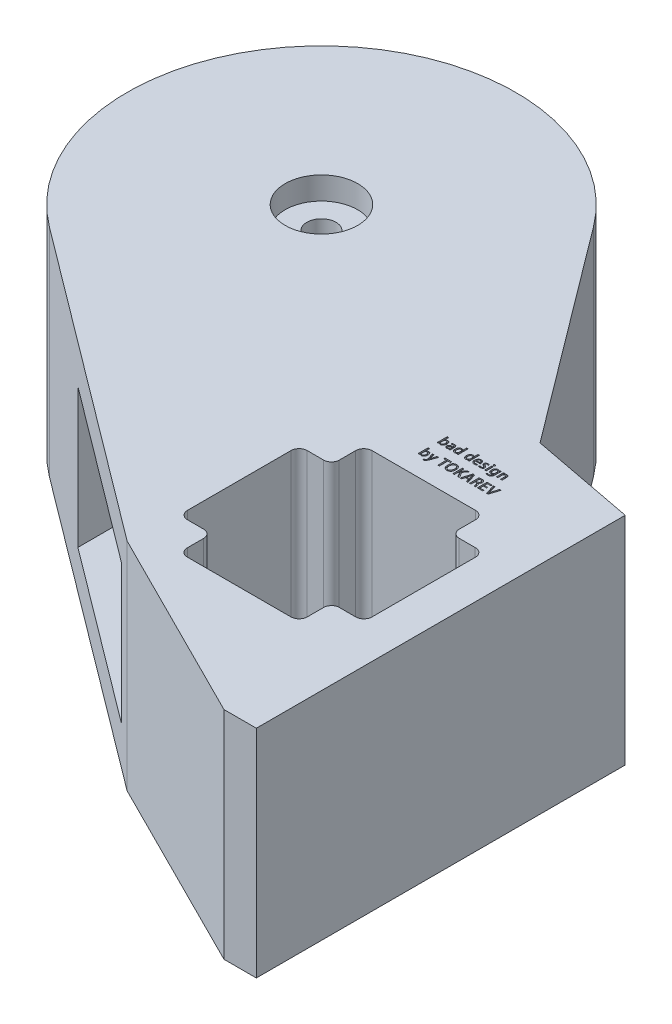
from build123d import *

# Parameters (mm, degrees)
EXTRUDE_1_DEPTH     = 66.8
CUT_EXTRUDE_1_DEPTH = 53
SKETCH_6_R          = 4.5
CUT_EXTRUDE_2_DEPTH = 73
SKETCH_11_R         = 11.2
CUT_EXTRUDE_3_DEPTH = 7
CUT_EXTRUDE_START   = -7
SKETCH_12_R         = 11.2
CUT_EXTRUDE_4_DEPTH = 7
SKETCH_19_W         = 0.45927657
SKETCH_19_H         = 2.167421367
CUT_EXTRUDE_5_DEPTH = 0.4
SKETCH_20_W         = 67
SKETCH_20_H         = 43


with BuildPart() as part:
    # Эскиз1 → Бобышка-Вытянуть1 (new body)
    with BuildSketch(Plane(origin=(0, 0, 0), x_dir=(1, 0, 0), z_dir=(0, 1, 0))):
        with BuildLine():
            Line((97.5, -30), (48, 36))
            ThreePointArc((48, 36), (-42.426406871, 42.426406871), (-36, -48))
            Line((-36, -48), (60, -120))
            Line((60, -120), (120, -150.1))
            Line((120, -150.1), (130, -150.1))
            Line((130, -150.1), (130, -36.19837126))
            Line((130, -36.19837126), (97.5, -30))
        make_face()
    extrude(amount=EXTRUDE_1_DEPTH)

    # Эскиз3 → Вырез-Вытянуть1 (cut)
    with BuildSketch(Plane(origin=(0, 66.8, 0), x_dir=(1, 0, 0), z_dir=(0, 1, 0))):
        with BuildLine():
            Line((71.1, -107.5), (71.1, -112.5))
            ThreePointArc((71.1, -112.5), (71.832233047, -114.267766953), (73.6, -115))
            Line((73.6, -115), (105.6, -115))
            ThreePointArc((105.6, -115), (107.389867075, -114.214412538), (108.1, -112.39329117))
            Line((108.1, -112.39329117), (108.1, -107.39329117))
            ThreePointArc((108.1, -107.39329117), (108.854333169, -105.678878632), (110.6, -105))
            Line((110.6, -105), (115.6, -105))
            ThreePointArc((115.6, -105), (117.367766953, -104.267766953), (118.1, -102.5))
            Line((118.1, -102.5), (118.1, -70.5))
            ThreePointArc((118.1, -70.5), (117.314412538, -68.710132925), (115.49329117, -68))
            Line((115.49329117, -68), (110.49329117, -68))
            ThreePointArc((110.49329117, -68), (108.778878632, -67.245666831), (108.1, -65.5))
            Line((108.1, -65.5), (108.1, -60.5))
            ThreePointArc((108.1, -60.5), (107.367766953, -58.732233047), (105.6, -58))
            Line((105.6, -58), (73.6, -58))
            ThreePointArc((73.6, -58), (71.810132925, -58.785587462), (71.1, -60.60670883))
            Line((71.1, -60.60670883), (71.1, -65.60670883))
            ThreePointArc((71.1, -65.60670883), (70.345666831, -67.321121368), (68.6, -68))
            Line((68.6, -68), (63.6, -68))
            ThreePointArc((63.6, -68), (61.832233047, -68.732233047), (61.1, -70.5))
            Line((61.1, -70.5), (61.1, -102.5))
            ThreePointArc((61.1, -102.5), (61.885587462, -104.289867075), (63.70670883, -105))
            Line((63.70670883, -105), (68.70670883, -105))
            ThreePointArc((68.70670883, -105), (70.421121368, -105.754333169), (71.1, -107.5))
        make_face()
    extrude(amount=-CUT_EXTRUDE_1_DEPTH, mode=Mode.SUBTRACT)

    # Эскиз6 → Вырез-Вытянуть2 (cut)
    with BuildSketch(Plane(origin=(0, 66.8, 0), x_dir=(1, 0, 0), z_dir=(0, 1, 0))):
        Circle(SKETCH_6_R)
    extrude(amount=-CUT_EXTRUDE_2_DEPTH, mode=Mode.SUBTRACT)

    # Эскиз11 → Вырез-Вытянуть3 (cut)
    with BuildSketch(Plane(origin=(0, 66.8, 0), x_dir=(1, 0, 0), z_dir=(0, 1, 0))):
        Circle(SKETCH_11_R)
    extrude(amount=-CUT_EXTRUDE_3_DEPTH, mode=Mode.SUBTRACT)

    # Эскиз12 → Вырез-Вытянуть4 (cut)
    with BuildSketch(Plane.XZ.offset(CUT_EXTRUDE_START)):
        Circle(SKETCH_12_R)
    extrude(amount=CUT_EXTRUDE_4_DEPTH, mode=Mode.SUBTRACT)

    # Эскиз19 → Вырез-Вытянуть5 (cut)
    # profile 1 of 19: a face of its own
    with BuildSketch(Plane(origin=(0, 66.8, 0), x_dir=(1, 0, 0), z_dir=(0, 1, 0))):
        with BuildLine():
            Line((81.983745506, -43.947912872), (81.983745506, -42.673059135))
            Line((81.983745506, -42.673059135), (81.524468936, -42.673059135))
            Line((81.524468936, -42.673059135), (81.524468936, -45.234060046))
            add(Edge.make_bspline(
                [(81.524468936, -45.234060046), (81.524024524, -45.284711331), (81.523126762, -45.387032809), (81.52016412, -45.514411979), (81.517354479, -45.614530136), (81.51435525, -45.684653832), (81.511611554, -45.749514392), (81.509594949, -45.790986576), (81.508632384, -45.810782065)],
                knots=[0, 0, 0, 0, 1.580181509, 3.192150096, 3.974768176, 4.704690038, 5.381723058, 6, 6, 6, 6], degree=3))
            Line((81.508632384, -45.810782065), (81.900600157, -45.810217007))
            Line((81.900600157, -45.810217007), (81.924355813, -45.48586293))
            Line((81.924355813, -45.48586293), (81.936233641, -45.48586293))
            add(Edge.make_bspline(
                [(81.936233641, -45.48586293), (81.954517234, -45.515147277), (81.99009714, -45.572134673), (82.054885275, -45.646663521), (82.125560284, -45.709686941), (82.202388502, -45.761104494), (82.28552632, -45.800544086), (82.37456926, -45.828356087), (82.469944492, -45.844596449), (82.535529249, -45.845425108), (82.569152746, -45.845849939)],
                knots=[0, 0, 0, 0, 1.079361466, 2.10043949, 3.078762628, 4.036375027, 4.984133248, 5.949210122, 6.948616549, 8, 8, 8, 8], degree=3))
            add(Edge.make_bspline(
                [(82.569152746, -45.845849939), (82.597664795, -45.845130781), (82.654212626, -45.843704478), (82.737731133, -45.83101648), (82.818716135, -45.809369874), (82.897256732, -45.778610844), (82.973206583, -45.738562434), (83.047191161, -45.690464417), (83.11781257, -45.632582268), (83.186647689, -45.567401196), (83.249983171, -45.492291129), (83.305913366, -45.407113934), (83.353214467, -45.312039332), (83.392949882, -45.207497358), (83.423562702, -45.092914463), (83.447331837, -44.96914822), (83.462387961, -44.835433686), (83.466399366, -44.743133775), (83.468474013, -44.69539745)],
                knots=[0, 0, 0, 0, 0.837711273, 1.661429363, 2.47605588, 3.297290833, 4.135112083, 4.995877715, 5.88647185, 6.815398095, 7.778987196, 8.767310322, 9.803272213, 10.894262116, 12.049113692, 13.284886553, 14.595778292, 16, 16, 16, 16], degree=3))
            add(Edge.make_bspline(
                [(83.468474013, -44.69539745), (83.467233927, -44.654649748), (83.464818053, -44.575267121), (83.453660877, -44.459374945), (83.435065278, -44.350120647), (83.409681206, -44.247416919), (83.377732273, -44.151229041), (83.337640044, -44.062199687), (83.292135297, -43.978939868), (83.238925845, -43.903295546), (83.180075492, -43.835573344), (83.11720179, -43.775301886), (83.048868831, -43.724797505), (82.975892431, -43.682914657), (82.897960159, -43.650926992), (82.815768542, -43.626786214), (82.728786799, -43.612033892), (82.669132495, -43.609181708), (82.638722882, -43.607727767)],
                knots=[0, 0, 0, 0, 1.277480107, 2.488722554, 3.645736135, 4.747848757, 5.801763705, 6.817533101, 7.804145906, 8.771368197, 9.70971165, 10.61259152, 11.495428575, 12.366158853, 13.242983327, 14.129353206, 15.046411737, 16, 16, 16, 16], degree=3))
            add(Edge.make_bspline(
                [(82.638722882, -43.607727767), (82.602451458, -43.608963294), (82.532134982, -43.611358512), (82.430726169, -43.628645501), (82.336806942, -43.6561335), (82.250868198, -43.695450279), (82.173129444, -43.744934296), (82.103192864, -43.803298325), (82.041271149, -43.870822177), (82.007933293, -43.92225375), (81.991098447, -43.948225504)],
                knots=[0, 0, 0, 0, 1.134639901, 2.199634582, 3.209484457, 4.188975806, 5.146471076, 6.084686313, 7.032810893, 8, 8, 8, 8], degree=3))
            Line((81.991098447, -43.948225504), (81.983745506, -43.947912872))
        make_face()
        with BuildLine():
            add(Edge.make_bspline(
                [(81.983745506, -44.529798853), (81.984363198, -44.511632641), (81.985595595, -44.475388107), (81.993187408, -44.422017779), (82.004519825, -44.370211697), (82.019675839, -44.320120052), (82.039735957, -44.272015115), (82.063323625, -44.225519612), (82.091582187, -44.181168581), (82.122527331, -44.138496124), (82.157636174, -44.099500555), (82.195468832, -44.064936932), (82.235918311, -44.035125578), (82.279079468, -44.010751627), (82.324716925, -43.991531654), (82.37256779, -43.97660261), (82.42323565, -43.966827408), (82.458062346, -43.964621964), (82.475826954, -43.963496998)],
                knots=[0, 0, 0, 0, 1.051202126, 2.097318495, 3.113830768, 4.118091199, 5.120987669, 6.126136643, 7.131107971, 8.161056062, 9.173108897, 10.161660459, 11.121809073, 12.074490442, 13.022851523, 13.982193992, 14.970745554, 16, 16, 16, 16], degree=3))
            add(Edge.make_bspline(
                [(82.475826954, -43.963496998), (82.497570219, -43.964651905), (82.539867275, -43.96689854), (82.600753858, -43.979191646), (82.657536371, -43.997119667), (82.709871729, -44.022368938), (82.758347219, -44.053486951), (82.802189945, -44.091434008), (82.842309114, -44.135193418), (82.876720347, -44.185848863), (82.90784535, -44.240481028), (82.934366246, -44.299110174), (82.956868181, -44.360787279), (82.975797403, -44.42552036), (82.989629584, -44.493488242), (82.999823802, -44.564494343), (83.006142877, -44.638723003), (83.007042152, -44.689351764), (83.007501162, -44.71519383)],
                knots=[0, 0, 0, 0, 1.012688948, 1.969978321, 2.883389375, 3.778690191, 4.667511061, 5.557848136, 6.471427934, 7.423672003, 8.402615762, 9.39656097, 10.415887588, 11.457798859, 12.533916005, 13.642628749, 14.796744348, 16, 16, 16, 16], degree=3))
            add(Edge.make_bspline(
                [(83.007501162, -44.71519383), (83.007104953, -44.743867376), (83.006332217, -44.799790058), (82.99922574, -44.881342268), (82.988809235, -44.958474663), (82.973628672, -45.031108371), (82.95363376, -45.099253836), (82.930171678, -45.163113868), (82.90236445, -45.222468461), (82.870290631, -45.276741265), (82.833959052, -45.325725065), (82.793934686, -45.368829555), (82.750035859, -45.405668738), (82.701636595, -45.435268667), (82.64970598, -45.459201259), (82.593695701, -45.475964906), (82.534133166, -45.487103704), (82.493035316, -45.489068652), (82.471867678, -45.490080708)],
                knots=[0, 0, 0, 0, 1.301955168, 2.53923337, 3.715046798, 4.835168444, 5.905484715, 6.937722498, 7.922115596, 8.878094384, 9.796004009, 10.686548312, 11.543870977, 12.389786557, 13.255745844, 14.133311203, 15.038553296, 16, 16, 16, 16], degree=3))
            add(Edge.make_bspline(
                [(82.471867678, -45.490080708), (82.453728828, -45.489145076), (82.417992709, -45.487301749), (82.366104112, -45.478011624), (82.316996666, -45.464485743), (82.270954535, -45.446236996), (82.227551448, -45.423803242), (82.187801145, -45.395400949), (82.15027772, -45.363404234), (82.116549958, -45.326423293), (82.086288597, -45.286526282), (82.059580552, -45.244540192), (82.03669269, -45.200704005), (82.01824836, -45.154974136), (82.003244545, -45.107551009), (81.99267568, -45.058308548), (81.98567694, -45.007241699), (81.98439475, -44.972569356), (81.983745506, -44.955012835)],
                knots=[0, 0, 0, 0, 1.081464079, 2.130638344, 3.13380487, 4.112319177, 5.077258135, 6.037278755, 7.017082277, 8.010956805, 9.013179115, 9.998122625, 10.973018057, 11.955716131, 12.93293952, 13.933459995, 14.953596711, 16, 16, 16, 16], degree=3))
            Line((81.983745506, -44.955012835), (81.983745506, -44.529798853))
        make_face(mode=Mode.SUBTRACT)
    # profile 2 of 19: a face of its own
    with BuildSketch(Plane(origin=(0, 66.8, 0), x_dir=(1, 0, 0), z_dir=(0, 1, 0))):
        with BuildLine():
            add(Edge.make_bspline(
                [(85.531256266, -44.497638573), (85.531291908, -44.467580608), (85.531362093, -44.408390325), (85.524378633, -44.321191658), (85.512085906, -44.237441833), (85.494111647, -44.157144192), (85.469580048, -44.080621966), (85.439735371, -44.007491123), (85.403785493, -43.938025989), (85.362346797, -43.872171754), (85.313094381, -43.811600382), (85.254756922, -43.758389752), (85.18717347, -43.713423973), (85.110487062, -43.676725807), (85.025031034, -43.647433098), (84.93085535, -43.625631974), (84.827859375, -43.61137066), (84.756229457, -43.608600439), (84.719039624, -43.607162156)],
                knots=[0, 0, 0, 0, 1.04529413, 2.058397975, 3.039753549, 3.988049356, 4.917306062, 5.832005784, 6.732558164, 7.634995369, 8.534400609, 9.439717093, 10.371077683, 11.347885902, 12.389132223, 13.507522911, 14.705920534, 16, 16, 16, 16], degree=3))
            add(Edge.make_bspline(
                [(84.719039624, -43.607162156), (84.684704561, -43.608076134), (84.617036476, -43.609877417), (84.517627649, -43.619505163), (84.422136315, -43.635172266), (84.331664084, -43.657462153), (84.246721983, -43.683245087), (84.168356293, -43.711907896), (84.097296307, -43.743832034), (84.053890544, -43.768773907), (84.032953651, -43.78080469)],
                knots=[0, 0, 0, 0, 1.151566781, 2.269526023, 3.346377101, 4.393757963, 5.391790339, 6.321988655, 7.190606464, 8, 8, 8, 8], degree=3))
            Line((84.032953651, -43.78080469), (84.129001997, -44.085829126))
            add(Edge.make_bspline(
                [(84.129001997, -44.085829126), (84.147156499, -44.074176312), (84.183772246, -44.050673795), (84.242570555, -44.020271142), (84.304540806, -43.992882238), (84.370034384, -43.970824315), (84.437118022, -43.951851111), (84.50537054, -43.938331158), (84.574422141, -43.93017378), (84.620601613, -43.929012722), (84.643813379, -43.928429124)],
                knots=[0, 0, 0, 0, 0.947965393, 1.911947826, 2.906762171, 3.923842573, 4.947454658, 5.969958628, 6.979614862, 8, 8, 8, 8], degree=3))
            add(Edge.make_bspline(
                [(84.643813379, -43.928429124), (84.667626605, -43.929999792), (84.713079487, -43.932997763), (84.777235276, -43.945161197), (84.83416687, -43.961331803), (84.884308872, -43.981897357), (84.926787236, -44.00893637), (84.962315092, -44.040581466), (84.990420916, -44.077618671), (85.015386514, -44.132984385), (85.036779385, -44.203285761), (85.055642745, -44.285278381), (85.064347812, -44.363798808), (85.061874503, -44.414469862), (85.060668583, -44.439175731)],
                knots=[0, 0, 0, 0, 1.124941475, 2.147203117, 3.073276344, 3.914150165, 4.693859246, 5.436944029, 6.148486199, 6.868538222, 8.288979618, 9.609682438, 10.834544209, 12, 12, 12, 12], degree=3))
            add(Edge.make_bspline(
                [(85.060668583, -44.439175731), (85.016916928, -44.439724349), (84.931401858, -44.440796655), (84.806527, -44.448969714), (84.688717091, -44.464330071), (84.577875333, -44.485327806), (84.473608058, -44.511252606), (84.376613467, -44.545025386), (84.2861738, -44.583873601), (84.202951115, -44.628865331), (84.12769004, -44.680170612), (84.062093168, -44.7386068), (84.006782403, -44.80398067), (83.960140245, -44.875062945), (83.924651613, -44.953685021), (83.897887105, -45.038276346), (83.881344034, -45.129734318), (83.878373709, -45.192878266), (83.876845054, -45.225374826)],
                knots=[0, 0, 0, 0, 1.312583045, 2.565517338, 3.751913568, 4.874585872, 5.948775456, 6.97196923, 7.952367169, 8.899011352, 9.80588498, 10.679130641, 11.525793372, 12.368308044, 13.221239438, 14.104974037, 15.024739096, 16, 16, 16, 16], degree=3))
            add(Edge.make_bspline(
                [(83.876845054, -45.225374826), (83.877663343, -45.246510011), (83.879268925, -45.287979788), (83.886997286, -45.349052793), (83.900997752, -45.407364271), (83.918643359, -45.463723866), (83.942847592, -45.517156988), (83.971699559, -45.568027537), (84.005331473, -45.616712665), (84.044214013, -45.662129609), (84.087460088, -45.704277811), (84.136022983, -45.740457752), (84.188334976, -45.7717063), (84.244689755, -45.79805882), (84.305709935, -45.818196368), (84.370792722, -45.833495614), (84.440305436, -45.84310543), (84.488052416, -45.845291852), (84.51259166, -45.84641555)],
                knots=[0, 0, 0, 0, 1.019558823, 2.000497171, 2.961865832, 3.90763667, 4.843526869, 5.78386522, 6.724423229, 7.691661655, 8.662438953, 9.629634663, 10.603980382, 11.596308817, 12.622532153, 13.696327026, 14.81604254, 16, 16, 16, 16], degree=3))
            add(Edge.make_bspline(
                [(84.51259166, -45.84641555), (84.544158728, -45.845344278), (84.605816984, -45.84325182), (84.694827866, -45.826527131), (84.778581664, -45.802813162), (84.855482287, -45.767953109), (84.925308371, -45.725332904), (84.988885723, -45.677732288), (85.044984824, -45.623887983), (85.076233252, -45.58325607), (85.09177718, -45.563044509)],
                knots=[0, 0, 0, 0, 1.130657597, 2.208452709, 3.237069398, 4.244418774, 5.223812689, 6.164576675, 7.087004055, 8, 8, 8, 8], degree=3))
            Line((85.09177718, -45.563044509), (85.104494035, -45.562933486))
            Line((85.104494035, -45.562933486), (85.137007821, -45.810217007))
            Line((85.137007821, -45.810217007), (85.562532779, -45.810217007))
            add(Edge.make_bspline(
                [(85.562532779, -45.810217007), (85.556431159, -45.772389432), (85.543581499, -45.692726749), (85.535555345, -45.567297166), (85.531109377, -45.433937186), (85.530831913, -45.342838948), (85.530691207, -45.296641794)],
                knots=[0, 0, 0, 0, 0.891962436, 1.878421288, 2.924118623, 4, 4, 4, 4], degree=3))
            Line((85.530691207, -45.296641794), (85.531256266, -44.497638573))
        make_face()
        with BuildLine():
            add(Edge.make_bspline(
                [(85.071980248, -45.080983321), (85.071119299, -45.096900581), (85.069434107, -45.128056493), (85.062354613, -45.173656864), (85.052615761, -45.217181841), (85.038109219, -45.258129093), (85.020750019, -45.29700209), (84.998780782, -45.333231015), (84.974241209, -45.368016496), (84.945116121, -45.399425883), (84.913834152, -45.428183793), (84.880127198, -45.453121368), (84.84509755, -45.474868477), (84.80783765, -45.492445018), (84.768720803, -45.506777707), (84.727532716, -45.516756866), (84.684535779, -45.523115822), (84.655335846, -45.524461283), (84.640419714, -45.525148581)],
                knots=[0, 0, 0, 0, 1.109602252, 2.171898408, 3.210306776, 4.211169819, 5.192546091, 6.169960748, 7.157642555, 8.152283629, 9.146924703, 10.113428095, 11.068354029, 12.014025355, 12.977759263, 13.965091819, 14.960512766, 16, 16, 16, 16], degree=3))
            add(Edge.make_bspline(
                [(84.640419714, -45.525148581), (84.620314838, -45.524518076), (84.580933463, -45.523283045), (84.524486913, -45.506439973), (84.472569089, -45.480025462), (84.425560218, -45.443115989), (84.386199179, -45.393953323), (84.357997503, -45.332284575), (84.340552141, -45.259109292), (84.338028663, -45.206439055), (84.336686683, -45.178429124)],
                knots=[0, 0, 0, 0, 0.925162071, 1.812204857, 2.691873356, 3.602553412, 4.549923018, 5.56994314, 6.707700436, 8, 8, 8, 8], degree=3))
            add(Edge.make_bspline(
                [(84.336686683, -45.178429124), (84.338477736, -45.155939489), (84.341937, -45.11250273), (84.354619256, -45.050307739), (84.375327269, -44.994313541), (84.401882384, -44.944074399), (84.43499393, -44.899439865), (84.475973651, -44.862136127), (84.522749308, -44.829777687), (84.594727767, -44.796814338), (84.691757073, -44.765676385), (84.813354278, -44.738945037), (84.940778231, -44.724468458), (85.027263501, -44.724694049), (85.071415189, -44.724809215)],
                knots=[0, 0, 0, 0, 0.831751151, 1.606454387, 2.332498033, 3.02628555, 3.696675427, 4.370806108, 5.061344671, 5.786088267, 7.281491765, 8.811961156, 10.372470837, 12, 12, 12, 12], degree=3))
            Line((85.071415189, -44.724809215), (85.071980248, -45.080983321))
        make_face(mode=Mode.SUBTRACT)
    # profile 3 of 19: a face of its own
    with BuildSketch(Plane(origin=(0, 66.8, 0), x_dir=(1, 0, 0), z_dir=(0, 1, 0))):
        with BuildLine():
            Line((87.992794727, -42.673059135), (87.533518157, -42.673059135))
            Line((87.533518157, -42.673059135), (87.533518157, -43.893608706))
            Line((87.533518157, -43.893608706), (87.525594081, -43.893608706))
            add(Edge.make_bspline(
                [(87.525594081, -43.893608706), (87.512602923, -43.873479042), (87.48634912, -43.832799048), (87.435301776, -43.778813041), (87.375724967, -43.730000568), (87.306751133, -43.687529081), (87.229487372, -43.652210603), (87.143268056, -43.627755117), (87.049575017, -43.611546881), (86.984194309, -43.609029794), (86.950374465, -43.607727767)],
                knots=[0, 0, 0, 0, 0.854303985, 1.726461014, 2.640569424, 3.599363016, 4.612154858, 5.664979792, 6.792151047, 8, 8, 8, 8], degree=3))
            add(Edge.make_bspline(
                [(86.950374465, -43.607727767), (86.919764327, -43.608693404), (86.859317179, -43.610600288), (86.770879309, -43.626106927), (86.68569286, -43.648939782), (86.604449294, -43.682248023), (86.526595907, -43.724171563), (86.452629571, -43.775643273), (86.382330788, -43.836060405), (86.315628341, -43.904660787), (86.25489235, -43.982434204), (86.201704462, -44.068767134), (86.156208204, -44.163347694), (86.119239913, -44.266221751), (86.089167805, -44.376836104), (86.06740335, -44.495463914), (86.053205189, -44.622114639), (86.049918088, -44.709312027), (86.048225144, -44.75422098)],
                knots=[0, 0, 0, 0, 0.900512761, 1.778281058, 2.635992154, 3.492463302, 4.356668303, 5.234226012, 6.139634244, 7.081658826, 8.046461591, 9.038373575, 10.061110518, 11.13039217, 12.251937016, 13.431943807, 14.677383403, 16, 16, 16, 16], degree=3))
            add(Edge.make_bspline(
                [(86.048225144, -44.75422098), (86.049525966, -44.795360796), (86.052062343, -44.875576319), (86.065550858, -44.99249208), (86.084782545, -45.102829554), (86.111987819, -45.206344982), (86.146446728, -45.302945607), (86.188330979, -45.392820181), (86.237784628, -45.475686254), (86.293628723, -45.551683932), (86.355708958, -45.61930798), (86.422301149, -45.678519082), (86.492787491, -45.729678693), (86.568240791, -45.770769529), (86.647875232, -45.803532253), (86.731744635, -45.827114314), (86.819939174, -45.842254529), (86.880177626, -45.844638676), (86.910781705, -45.845849939)],
                knots=[0, 0, 0, 0, 1.269363777, 2.47503966, 3.627412454, 4.722241937, 5.772804211, 6.787639336, 7.776213718, 8.745293268, 9.692175796, 10.60271892, 11.490535326, 12.373019568, 13.246873703, 14.141731334, 15.055908636, 16, 16, 16, 16], degree=3))
            add(Edge.make_bspline(
                [(86.910781705, -45.845849939), (86.948417658, -45.844465976), (87.021437058, -45.841780881), (87.126477249, -45.820194094), (87.224324028, -45.789501544), (87.312594158, -45.743984467), (87.392100045, -45.689633284), (87.462031597, -45.627254963), (87.522271301, -45.557131567), (87.553126812, -45.504549441), (87.568587135, -45.47820288)],
                knots=[0, 0, 0, 0, 1.140130952, 2.212025249, 3.240740653, 4.240451437, 5.210947522, 6.15434082, 7.075222383, 8, 8, 8, 8], degree=3))
            Line((87.568587135, -45.47820288), (87.581029469, -45.47799409))
            Line((87.581029469, -45.47799409), (87.604785125, -45.810217007))
            Line((87.604785125, -45.810217007), (88.008432984, -45.810217007))
            add(Edge.make_bspline(
                [(88.008432984, -45.810217007), (88.007319042, -45.790234273), (88.004997162, -45.748582607), (88.002373652, -45.683521113), (87.999335401, -45.613399364), (87.996554544, -45.513657253), (87.99355531, -45.38658914), (87.992669886, -45.284577399), (87.992229669, -45.233858989)],
                knots=[0, 0, 0, 0, 0.624723415, 1.302162672, 2.032522506, 2.815610177, 4.416778396, 6, 6, 6, 6], degree=3))
            Line((87.992229669, -45.233858989), (87.992794727, -42.673059135))
        make_face()
        with BuildLine():
            add(Edge.make_bspline(
                [(87.533518157, -44.924034041), (87.532655272, -44.943431583), (87.530964818, -44.981432749), (87.523922604, -45.037102636), (87.514153135, -45.090597231), (87.499212056, -45.141616135), (87.480534618, -45.190442892), (87.458017104, -45.236939708), (87.430952638, -45.28080956), (87.40090189, -45.322370032), (87.367134479, -45.360476775), (87.329451301, -45.393371058), (87.28916555, -45.421625215), (87.246285494, -45.446079939), (87.199919456, -45.464416085), (87.150775495, -45.47793732), (87.09890631, -45.487388983), (87.063161531, -45.489168279), (87.044831479, -45.490080708)],
                knots=[0, 0, 0, 0, 1.11733188, 2.188932698, 3.227711344, 4.244483357, 5.244255886, 6.234497817, 7.213613753, 8.207892174, 9.184055964, 10.137694795, 11.080212998, 12.013183923, 12.972549626, 13.941628043, 14.944459428, 16, 16, 16, 16], degree=3))
            add(Edge.make_bspline(
                [(87.044831479, -45.490080708), (87.023663219, -45.488864052), (86.982357831, -45.486490004), (86.922562495, -45.474946765), (86.866687072, -45.457458781), (86.814487805, -45.433490692), (86.766500849, -45.402867716), (86.722183977, -45.366043534), (86.681994766, -45.322833775), (86.646008228, -45.27341351), (86.613978784, -45.219349899), (86.586370404, -45.161288397), (86.56215377, -45.099830916), (86.543528445, -45.034346695), (86.527827243, -44.965500172), (86.5175609, -44.893032795), (86.51035989, -44.816959634), (86.509591354, -44.764985693), (86.509197995, -44.738383875)],
                knots=[0, 0, 0, 0, 0.984741306, 1.92151474, 2.822341362, 3.700719327, 4.583284636, 5.460787722, 6.372294446, 7.31885594, 8.297337404, 9.289073803, 10.304649099, 11.364052331, 12.450586518, 13.584680478, 14.763767201, 16, 16, 16, 16], degree=3))
            add(Edge.make_bspline(
                [(86.509197995, -44.738383875), (86.509610595, -44.711408461), (86.510416968, -44.658688501), (86.517374259, -44.581227341), (86.528664133, -44.507401628), (86.54372845, -44.436807797), (86.56374876, -44.370004478), (86.587170904, -44.306426611), (86.615878182, -44.246597975), (86.648247094, -44.190382563), (86.684663579, -44.138786159), (86.725589663, -44.093626972), (86.77070113, -44.055562836), (86.819318527, -44.023330692), (86.871925751, -43.997739322), (86.928953043, -43.979727893), (86.989498741, -43.967686555), (87.031390087, -43.96491181), (87.052750031, -43.963496998)],
                knots=[0, 0, 0, 0, 1.225621097, 2.395317913, 3.530655392, 4.617908651, 5.672398338, 6.697199995, 7.693566205, 8.683984347, 9.642081535, 10.557834763, 11.445297679, 12.317367365, 13.202511412, 14.093894327, 15.028097378, 16, 16, 16, 16], degree=3))
            add(Edge.make_bspline(
                [(87.052750031, -43.963496998), (87.068999052, -43.964076165), (87.100908374, -43.965213516), (87.147772398, -43.973160892), (87.193123715, -43.983915762), (87.23628131, -44.000628269), (87.277366188, -44.02176217), (87.316565915, -44.047393759), (87.354021962, -44.077570367), (87.389456558, -44.111981219), (87.42252271, -44.150145736), (87.450600137, -44.193012678), (87.475335887, -44.239012238), (87.494935863, -44.289251335), (87.51081012, -44.343190633), (87.522432488, -44.400922274), (87.530698827, -44.462329199), (87.532188188, -44.50457), (87.532953651, -44.526279803)],
                knots=[0, 0, 0, 0, 0.942889546, 1.851617199, 2.754193781, 3.64454257, 4.530575145, 5.432222125, 6.358705653, 7.318532238, 8.296779482, 9.283379888, 10.287134613, 11.323711729, 12.407743404, 13.547584689, 14.73957287, 16, 16, 16, 16], degree=3))
            Line((87.532953651, -44.526279803), (87.533518157, -44.924034041))
        make_face(mode=Mode.SUBTRACT)
    # profile 4 of 19: a face of its own
    with BuildSketch(Plane(origin=(0, 66.8, 0), x_dir=(1, 0, 0), z_dir=(0, 1, 0))):
        with BuildLine():
            Line((91.46790785, -42.673059135), (91.008631279, -42.673059135))
            Line((91.008631279, -42.673059135), (91.008631279, -43.893608706))
            Line((91.008631279, -43.893608706), (91.000707204, -43.893608706))
            add(Edge.make_bspline(
                [(91.000707204, -43.893608706), (90.987716045, -43.873479042), (90.961462242, -43.832799048), (90.910414898, -43.778813041), (90.850838089, -43.730000568), (90.781864256, -43.687529081), (90.704600494, -43.652210603), (90.618381178, -43.627755117), (90.524688139, -43.611546881), (90.459307432, -43.609029794), (90.425487587, -43.607727767)],
                knots=[0, 0, 0, 0, 0.854303985, 1.726461014, 2.640569424, 3.599363016, 4.612154858, 5.664979792, 6.792151047, 8, 8, 8, 8], degree=3))
            add(Edge.make_bspline(
                [(90.425487587, -43.607727767), (90.39487745, -43.608693404), (90.334430301, -43.610600288), (90.245992431, -43.626106927), (90.160805982, -43.648939782), (90.079562416, -43.682248023), (90.001709029, -43.724171563), (89.927742693, -43.775643273), (89.85744391, -43.836060405), (89.790741463, -43.904660787), (89.730005472, -43.982434204), (89.676817584, -44.068767134), (89.631321326, -44.163347694), (89.594353035, -44.266221751), (89.564280927, -44.376836104), (89.542516473, -44.495463914), (89.528318311, -44.622114639), (89.52503121, -44.709312027), (89.523338266, -44.75422098)],
                knots=[0, 0, 0, 0, 0.900512761, 1.778281058, 2.635992154, 3.492463302, 4.356668303, 5.234226012, 6.139634244, 7.081658826, 8.046461591, 9.038373575, 10.061110518, 11.13039217, 12.251937016, 13.431943807, 14.677383403, 16, 16, 16, 16], degree=3))
            add(Edge.make_bspline(
                [(89.523338266, -44.75422098), (89.524639088, -44.795360796), (89.527175465, -44.875576319), (89.54066398, -44.99249208), (89.559895667, -45.102829554), (89.587100941, -45.206344982), (89.62155985, -45.302945607), (89.663444101, -45.392820181), (89.712897751, -45.475686254), (89.768741845, -45.551683932), (89.83082208, -45.61930798), (89.897414271, -45.678519082), (89.967900613, -45.729678693), (90.043353913, -45.770769529), (90.122988354, -45.803532253), (90.206857757, -45.827114314), (90.295052296, -45.842254529), (90.355290748, -45.844638676), (90.385894827, -45.845849939)],
                knots=[0, 0, 0, 0, 1.269363777, 2.47503966, 3.627412454, 4.722241937, 5.772804211, 6.787639336, 7.776213718, 8.745293268, 9.692175796, 10.60271892, 11.490535326, 12.373019568, 13.246873703, 14.141731334, 15.055908636, 16, 16, 16, 16], degree=3))
            add(Edge.make_bspline(
                [(90.385894827, -45.845849939), (90.42353078, -45.844465976), (90.49655018, -45.841780881), (90.601590371, -45.820194094), (90.69943715, -45.789501544), (90.78770728, -45.743984467), (90.867213167, -45.689633284), (90.937144719, -45.627254963), (90.997384423, -45.557131567), (91.028239934, -45.504549441), (91.043700257, -45.47820288)],
                knots=[0, 0, 0, 0, 1.140130952, 2.212025249, 3.240740653, 4.240451437, 5.210947522, 6.15434082, 7.075222383, 8, 8, 8, 8], degree=3))
            Line((91.043700257, -45.47820288), (91.056142591, -45.47799409))
            Line((91.056142591, -45.47799409), (91.079898247, -45.810217007))
            Line((91.079898247, -45.810217007), (91.483546106, -45.810217007))
            add(Edge.make_bspline(
                [(91.483546106, -45.810217007), (91.482432165, -45.790234273), (91.480110284, -45.748582607), (91.477486774, -45.683521113), (91.474448523, -45.613399364), (91.471667666, -45.513657253), (91.468668432, -45.38658914), (91.467783008, -45.284577399), (91.467342791, -45.233858989)],
                knots=[0, 0, 0, 0, 0.624723415, 1.302162672, 2.032522506, 2.815610177, 4.416778396, 6, 6, 6, 6], degree=3))
            Line((91.467342791, -45.233858989), (91.46790785, -42.673059135))
        make_face()
        with BuildLine():
            add(Edge.make_bspline(
                [(91.008631279, -44.924034041), (91.007768394, -44.943431583), (91.006077941, -44.981432749), (90.999035727, -45.037102636), (90.989266258, -45.090597231), (90.974325178, -45.141616135), (90.95564774, -45.190442892), (90.933130226, -45.236939708), (90.906065761, -45.28080956), (90.876015012, -45.322370032), (90.842247601, -45.360476775), (90.804564423, -45.393371058), (90.764278672, -45.421625215), (90.721398616, -45.446079939), (90.675032579, -45.464416085), (90.625888617, -45.47793732), (90.574019433, -45.487388983), (90.538274653, -45.489168279), (90.519944601, -45.490080708)],
                knots=[0, 0, 0, 0, 1.11733188, 2.188932698, 3.227711344, 4.244483357, 5.244255886, 6.234497817, 7.213613753, 8.207892174, 9.184055964, 10.137694795, 11.080212998, 12.013183923, 12.972549626, 13.941628043, 14.944459428, 16, 16, 16, 16], degree=3))
            add(Edge.make_bspline(
                [(90.519944601, -45.490080708), (90.498776342, -45.488864052), (90.457470953, -45.486490004), (90.397675617, -45.474946765), (90.341800194, -45.457458781), (90.289600927, -45.433490692), (90.241613971, -45.402867716), (90.197297099, -45.366043534), (90.157107888, -45.322833775), (90.12112135, -45.27341351), (90.089091906, -45.219349899), (90.061483527, -45.161288397), (90.037266892, -45.099830916), (90.018641567, -45.034346695), (90.002940365, -44.965500172), (89.992674022, -44.893032795), (89.985473012, -44.816959634), (89.984704477, -44.764985693), (89.984311117, -44.738383875)],
                knots=[0, 0, 0, 0, 0.984741306, 1.92151474, 2.822341362, 3.700719327, 4.583284636, 5.460787722, 6.372294446, 7.31885594, 8.297337404, 9.289073803, 10.304649099, 11.364052331, 12.450586518, 13.584680478, 14.763767201, 16, 16, 16, 16], degree=3))
            add(Edge.make_bspline(
                [(89.984311117, -44.738383875), (89.984723717, -44.711408461), (89.98553009, -44.658688501), (89.992487381, -44.581227341), (90.003777255, -44.507401628), (90.018841572, -44.436807797), (90.038861882, -44.370004478), (90.062284026, -44.306426611), (90.090991304, -44.246597975), (90.123360217, -44.190382563), (90.159776701, -44.138786159), (90.200702785, -44.093626972), (90.245814252, -44.055562836), (90.294431649, -44.023330692), (90.347038873, -43.997739322), (90.404066165, -43.979727893), (90.464611863, -43.967686555), (90.50650321, -43.96491181), (90.527863153, -43.963496998)],
                knots=[0, 0, 0, 0, 1.225621097, 2.395317913, 3.530655392, 4.617908651, 5.672398338, 6.697199995, 7.693566205, 8.683984347, 9.642081535, 10.557834763, 11.445297679, 12.317367365, 13.202511412, 14.093894327, 15.028097378, 16, 16, 16, 16], degree=3))
            add(Edge.make_bspline(
                [(90.527863153, -43.963496998), (90.544112174, -43.964076165), (90.576021497, -43.965213516), (90.62288552, -43.973160892), (90.668236837, -43.983915762), (90.711394432, -44.000628269), (90.75247931, -44.02176217), (90.791679038, -44.047393759), (90.829135085, -44.077570367), (90.86456968, -44.111981219), (90.897635833, -44.150145736), (90.92571326, -44.193012678), (90.950449009, -44.239012238), (90.970048985, -44.289251335), (90.985923242, -44.343190633), (90.997545611, -44.400922274), (91.005811949, -44.462329199), (91.007301311, -44.50457), (91.008066773, -44.526279803)],
                knots=[0, 0, 0, 0, 0.942889546, 1.851617199, 2.754193781, 3.64454257, 4.530575145, 5.432222125, 6.358705653, 7.318532238, 8.296779482, 9.283379888, 10.287134613, 11.323711729, 12.407743404, 13.547584689, 14.73957287, 16, 16, 16, 16], degree=3))
            Line((91.008066773, -44.526279803), (91.008631279, -44.924034041))
        make_face(mode=Mode.SUBTRACT)
    # profile 5 of 19: a face of its own
    with BuildSketch(Plane(origin=(0, 66.8, 0), x_dir=(1, 0, 0), z_dir=(0, 1, 0))):
        with BuildLine():
            add(Edge.make_bspline(
                [(93.676775678, -45.389915112), (93.658880592, -45.397090509), (93.622167275, -45.411811455), (93.564513926, -45.430871908), (93.503338893, -45.447763941), (93.438310977, -45.462769913), (93.368054439, -45.474536824), (93.292021714, -45.483713346), (93.20948215, -45.48845326), (93.152490929, -45.489524324), (93.122885778, -45.490080708)],
                knots=[0, 0, 0, 0, 0.816449075, 1.675015937, 2.570090404, 3.503798727, 4.500212016, 5.58578228, 6.745889613, 8, 8, 8, 8], degree=3))
            add(Edge.make_bspline(
                [(93.122885778, -45.490080708), (93.100624884, -45.48984153), (93.056952507, -45.489372301), (92.992611615, -45.483105627), (92.930725422, -45.471820841), (92.871075317, -45.455408864), (92.813987826, -45.433835884), (92.75917503, -45.407736064), (92.707251192, -45.376472432), (92.657677914, -45.341003676), (92.611862899, -45.299606641), (92.571871429, -45.251232591), (92.536774267, -45.196887512), (92.508409412, -45.135944572), (92.484252077, -45.069232795), (92.466636296, -44.9961812), (92.453915416, -44.916936614), (92.450465846, -44.861924228), (92.448677633, -44.8334065)],
                knots=[0, 0, 0, 0, 1.004473861, 1.970619904, 2.913666576, 3.840642582, 4.758945718, 5.664823492, 6.576954953, 7.491029442, 8.41263867, 9.355109247, 10.315843508, 11.324526001, 12.382372671, 13.513400112, 14.710977933, 16, 16, 16, 16], degree=3))
            Line((92.448677633, -44.8334065), (93.848723589, -44.832841441))
            add(Edge.make_bspline(
                [(93.848723589, -44.832841441), (93.852222598, -44.80704903), (93.859782647, -44.751321288), (93.859843851, -44.695070669), (93.859876728, -44.664854464)],
                knots=[0, 0, 0, 0, 0.925657864, 2, 2, 2, 2], degree=3))
            add(Edge.make_bspline(
                [(93.859876728, -44.664854464), (93.859567972, -44.629017021), (93.858960905, -44.558554374), (93.850437607, -44.454778105), (93.83519192, -44.355199277), (93.813735227, -44.259911076), (93.786150514, -44.169002635), (93.751491262, -44.082523675), (93.709876666, -44.000439038), (93.663024292, -43.922245221), (93.608383666, -43.850535917), (93.545002138, -43.787731542), (93.473597497, -43.734186428), (93.394244931, -43.689497683), (93.306235963, -43.65545804), (93.2108041, -43.629204248), (93.106990147, -43.612999456), (93.035082659, -43.609152263), (92.997885778, -43.607162156)],
                knots=[0, 0, 0, 0, 1.113121608, 2.188590698, 3.231524324, 4.240398316, 5.220519018, 6.179837158, 7.130696028, 8.076961612, 9.008335956, 9.923659246, 10.83973185, 11.773313681, 12.743513307, 13.763749156, 14.843214244, 16, 16, 16, 16], degree=3))
            add(Edge.make_bspline(
                [(92.997885778, -43.607162156), (92.959550539, -43.608877933), (92.884964776, -43.61221618), (92.776491055, -43.629376408), (92.675171306, -43.656555354), (92.580167226, -43.692610632), (92.492619225, -43.739491793), (92.411471517, -43.795558984), (92.338380326, -43.862701668), (92.27160947, -43.937906543), (92.212279001, -44.020969937), (92.161624403, -44.110841402), (92.117722093, -44.205912304), (92.081246211, -44.306837419), (92.054029136, -44.414180602), (92.033599042, -44.526978624), (92.020966175, -44.645528869), (92.019166468, -44.726474933), (92.018247768, -44.76779564)],
                knots=[0, 0, 0, 0, 1.077396504, 2.096202933, 3.077775868, 4.020080645, 4.944168237, 5.861017532, 6.78343394, 7.725158009, 8.681968589, 9.64506222, 10.619075267, 11.620944368, 12.65508274, 13.726198823, 14.839287928, 16, 16, 16, 16], degree=3))
            add(Edge.make_bspline(
                [(92.018247768, -44.76779564), (92.019122657, -44.807236432), (92.020835506, -44.884453225), (92.034045707, -44.997221397), (92.055439924, -45.103925865), (92.084952316, -45.204622834), (92.122123058, -45.299530707), (92.168087873, -45.388333521), (92.222951875, -45.470634237), (92.28477237, -45.547273644), (92.35527817, -45.615894037), (92.43311387, -45.676291883), (92.518616851, -45.72742281), (92.611437005, -45.769422441), (92.711843685, -45.802152346), (92.819395027, -45.826243043), (92.934476062, -45.841824583), (93.013672104, -45.844481832), (93.054446863, -45.845849939)],
                knots=[0, 0, 0, 0, 1.119307265, 2.191368746, 3.217819697, 4.20508808, 5.166072403, 6.106755345, 7.037398497, 7.969333271, 8.896523305, 9.823527987, 10.759678815, 11.717678244, 12.709389534, 13.751911659, 14.842552517, 16, 16, 16, 16], degree=3))
            add(Edge.make_bspline(
                [(93.054446863, -45.845849939), (93.091418599, -45.845330104), (93.163187494, -45.844321009), (93.26751369, -45.835880962), (93.365565582, -45.824492268), (93.45706621, -45.80796131), (93.541584535, -45.788282649), (93.618631195, -45.766302514), (93.688018062, -45.742476641), (93.730477975, -45.723233599), (93.750713832, -45.714062608)],
                knots=[0, 0, 0, 0, 1.242786686, 2.412476118, 3.517118367, 4.560308987, 5.536651868, 6.43345837, 7.253406084, 8, 8, 8, 8], degree=3))
            Line((93.750713832, -45.714062608), (93.676775678, -45.389915112))
        make_face()
        with BuildLine():
            add(Edge.make_bspline(
                [(92.452718105, -44.547773016), (92.456694249, -44.510298086), (92.464674039, -44.435089041), (92.493021615, -44.324552243), (92.534576714, -44.216718491), (92.578033185, -44.129772904), (92.62037026, -44.064468722), (92.657279311, -44.021333036), (92.698287205, -43.984194735), (92.743466245, -43.953136576), (92.793186174, -43.928969208), (92.846809611, -43.910018286), (92.904829423, -43.897655133), (92.945041008, -43.894068082), (92.965645959, -43.892230029)],
                knots=[0, 0, 0, 0, 1.480585291, 2.971410676, 4.471042306, 6.019659947, 6.78467367, 7.52618554, 8.245416092, 8.954949748, 9.674524201, 10.413213234, 11.186909408, 12, 12, 12, 12], degree=3))
            add(Edge.make_bspline(
                [(92.965645959, -43.892230029), (92.98700917, -43.893813636), (93.028374651, -43.896879967), (93.087704053, -43.909386641), (93.141615794, -43.928314177), (93.191286294, -43.951783263), (93.234969002, -43.98287433), (93.274048181, -44.019397253), (93.307578271, -44.06226532), (93.344648272, -44.126863355), (93.381109417, -44.213416416), (93.411925046, -44.321891114), (93.429531335, -44.433871462), (93.429851346, -44.509628537), (93.430012474, -44.547773016)],
                knots=[0, 0, 0, 0, 0.853261208, 1.652165519, 2.407983148, 3.127271917, 3.834084808, 4.535885489, 5.25305095, 5.994191112, 7.499104421, 8.983593183, 10.48120762, 12, 12, 12, 12], degree=3))
            Line((93.430012474, -44.547773016), (92.452718105, -44.547773016))
        make_face(mode=Mode.SUBTRACT)
    # profile 6 of 19: a face of its own
    with BuildSketch(Plane(origin=(0, 66.8, 0), x_dir=(1, 0, 0), z_dir=(0, 1, 0))):
        with BuildLine():
            add(Edge.make_bspline(
                [(95.593656842, -43.727537293), (95.578246421, -43.719420914), (95.546159373, -43.702521267), (95.493937774, -43.680879873), (95.436821532, -43.660405618), (95.374678873, -43.642477678), (95.307925311, -43.627033735), (95.236874272, -43.615859642), (95.161852259, -43.609084056), (95.110644894, -43.607812999), (95.084424239, -43.607162156)],
                knots=[0, 0, 0, 0, 0.790642391, 1.64624841, 2.564352796, 3.545271256, 4.581756375, 5.674136116, 6.809044901, 8, 8, 8, 8], degree=3))
            add(Edge.make_bspline(
                [(95.084424239, -43.607162156), (95.056111655, -43.60802698), (95.001021647, -43.609709737), (94.92091315, -43.619736782), (94.845331438, -43.634046859), (94.774433764, -43.654584848), (94.70807159, -43.679864514), (94.646390293, -43.710569259), (94.589422641, -43.746890322), (94.537735205, -43.788901486), (94.490570369, -43.83423813), (94.450367108, -43.884024147), (94.415520406, -43.936369221), (94.386264177, -43.991881263), (94.364533697, -44.051203648), (94.34794536, -44.113052861), (94.337514165, -44.17808614), (94.335842619, -44.222508381), (94.33498985, -44.245171206)],
                knots=[0, 0, 0, 0, 1.232557026, 2.39828261, 3.510625914, 4.578343488, 5.607275675, 6.59838632, 7.572907593, 8.542021365, 9.493950285, 10.41567434, 11.321732644, 12.228534229, 13.140226264, 14.066034573, 15.013351922, 16, 16, 16, 16], degree=3))
            add(Edge.make_bspline(
                [(94.33498985, -44.245171206), (94.335209417, -44.261031516), (94.335642518, -44.292316246), (94.342326703, -44.338668951), (94.3525358, -44.38404946), (94.366369826, -44.428753341), (94.38557248, -44.472030105), (94.408108633, -44.514468865), (94.434818198, -44.55601999), (94.46612214, -44.596257213), (94.501928587, -44.635340565), (94.542324855, -44.673396343), (94.587571568, -44.710251981), (94.638134386, -44.74484396), (94.692506437, -44.7792608), (94.752259628, -44.811251694), (94.816619063, -44.842373274), (94.861676105, -44.861501175), (94.884763606, -44.871302427)],
                knots=[0, 0, 0, 0, 0.856587234, 1.689632787, 2.52529231, 3.369729621, 4.214105436, 5.080337869, 5.965134746, 6.880395043, 7.832582895, 8.827442884, 9.877904007, 10.983283696, 12.136980698, 13.354535059, 14.644447778, 16, 16, 16, 16], degree=3))
            add(Edge.make_bspline(
                [(94.884763606, -44.871302427), (94.915124394, -44.884256593), (94.972022254, -44.908533442), (95.048799443, -44.948889998), (95.111063351, -44.990338137), (95.161151929, -45.031774304), (95.1982442, -45.077233391), (95.223835783, -45.127070593), (95.238366408, -45.182131531), (95.239423179, -45.220386377), (95.239967225, -45.240080708)],
                knots=[0, 0, 0, 0, 1.442762864, 2.70382045, 3.785089876, 4.70858488, 5.534986822, 6.331202735, 7.140871051, 8, 8, 8, 8], degree=3))
            add(Edge.make_bspline(
                [(95.239967225, -45.240080708), (95.238907095, -45.260363447), (95.236857679, -45.299573485), (95.220116982, -45.355839353), (95.190491262, -45.405097754), (95.149814201, -45.448011913), (95.097415382, -45.48318358), (95.032409745, -45.506670286), (94.956564281, -45.522204624), (94.902011085, -45.524123902), (94.872885778, -45.525148581)],
                knots=[0, 0, 0, 0, 0.926253341, 1.790607691, 2.652379817, 3.530335468, 4.474579846, 5.508610133, 6.669876374, 8, 8, 8, 8], degree=3))
            add(Edge.make_bspline(
                [(94.872885778, -45.525148581), (94.849470406, -45.524251487), (94.802644976, -45.522457501), (94.733368977, -45.512204707), (94.664942833, -45.498509933), (94.599036559, -45.478463434), (94.536662434, -45.455646193), (94.479594853, -45.431219196), (94.42794799, -45.406744909), (94.3968761, -45.387776231), (94.381935551, -45.378655369)],
                knots=[0, 0, 0, 0, 1.084658042, 2.169069943, 3.239571971, 4.314482302, 5.356095303, 6.314775547, 7.189679907, 8, 8, 8, 8], degree=3))
            Line((94.381935551, -45.378655369), (94.280821011, -45.708199367))
            add(Edge.make_bspline(
                [(94.280821011, -45.708199367), (94.299644015, -45.718616903), (94.338364855, -45.740046838), (94.401460048, -45.766098704), (94.469557894, -45.78917741), (94.542178083, -45.809559358), (94.618867786, -45.825821936), (94.698554382, -45.837792988), (94.780957902, -45.844419201), (94.836675856, -45.84574325), (94.864967225, -45.84641555)],
                knots=[0, 0, 0, 0, 0.850566013, 1.749701077, 2.695608543, 3.694612093, 4.731869813, 5.795217647, 6.880498894, 8, 8, 8, 8], degree=3))
            add(Edge.make_bspline(
                [(94.864967225, -45.84641555), (94.895346903, -45.845932955), (94.954533448, -45.84499275), (95.040616948, -45.835961694), (95.12201553, -45.82345233), (95.19826866, -45.804848508), (95.269525925, -45.780860891), (95.33602231, -45.752499898), (95.39670015, -45.71729571), (95.453030748, -45.678776678), (95.503204056, -45.634329997), (95.546700128, -45.584879588), (95.584571374, -45.531471138), (95.615217199, -45.473252495), (95.63923156, -45.410413551), (95.65573556, -45.342918366), (95.666820723, -45.271162726), (95.66881062, -45.221834881), (95.669831479, -45.196528672)],
                knots=[0, 0, 0, 0, 1.24676585, 2.428984354, 3.550051774, 4.625738488, 5.646412354, 6.634306093, 7.587634385, 8.521663049, 9.431847425, 10.331105618, 11.220112273, 12.113421467, 13.024789866, 13.97468704, 14.960972399, 16, 16, 16, 16], degree=3))
            add(Edge.make_bspline(
                [(95.669831479, -45.196528672), (95.669357596, -45.177283226), (95.668425906, -45.139445231), (95.662245936, -45.083777982), (95.651423142, -45.030659927), (95.636829667, -44.979810774), (95.617351287, -44.931668658), (95.594206385, -44.885492216), (95.566422217, -44.841994881), (95.534315499, -44.800816661), (95.497985919, -44.761839057), (95.457488618, -44.724520647), (95.413642037, -44.688146036), (95.364988163, -44.654455166), (95.313160419, -44.621176779), (95.256286387, -44.591322591), (95.196283559, -44.561277023), (95.154111253, -44.543746845), (95.132501162, -44.534763966)],
                knots=[0, 0, 0, 0, 1.011504991, 1.988694905, 2.938987322, 3.857759074, 4.764915312, 5.664517443, 6.568909358, 7.472758258, 8.405319782, 9.365889263, 10.365677585, 11.396652559, 12.474332572, 13.600487623, 14.770432924, 16, 16, 16, 16], degree=3))
            add(Edge.make_bspline(
                [(95.132501162, -44.534763966), (95.101649875, -44.521272273), (95.044069146, -44.496091426), (94.965366235, -44.456944562), (94.901402652, -44.417918206), (94.849410901, -44.380605451), (94.810387392, -44.340124403), (94.783533961, -44.295298291), (94.767442408, -44.245878565), (94.766104108, -44.211355428), (94.765419714, -44.193700618)],
                knots=[0, 0, 0, 0, 1.513287444, 2.824394195, 3.946233521, 4.878268876, 5.693444857, 6.453425842, 7.209096388, 8, 8, 8, 8], degree=3))
            add(Edge.make_bspline(
                [(94.765419714, -44.193700618), (94.766316671, -44.175479999), (94.768061024, -44.140045515), (94.784126933, -44.089470112), (94.810026347, -44.043880322), (94.846270399, -44.003961456), (94.892131898, -43.970440904), (94.948374693, -43.947202217), (95.013258951, -43.93143613), (95.059808658, -43.929469227), (95.084424239, -43.928429124)],
                knots=[0, 0, 0, 0, 0.936480869, 1.821217909, 2.704247373, 3.618918188, 4.578631192, 5.605257511, 6.733655248, 8, 8, 8, 8], degree=3))
            add(Edge.make_bspline(
                [(95.084424239, -43.928429124), (95.106322088, -43.929201988), (95.149124699, -43.930712664), (95.211099095, -43.93890776), (95.269553909, -43.950396488), (95.323491853, -43.967474187), (95.372727175, -43.987838727), (95.418334611, -44.006764613), (95.457838935, -44.028540588), (95.481932691, -44.043887366), (95.493360891, -44.051166681)],
                knots=[0, 0, 0, 0, 1.214212174, 2.373358716, 3.461965897, 4.513348598, 5.503333175, 6.416134665, 7.248737728, 8, 8, 8, 8], degree=3))
            Line((95.493360891, -44.051166681), (95.593656842, -43.727537293))
        make_face()
    # profile 7 of 19: a face of its own
    with BuildSketch(Plane(origin=(0, 66.8, 0), x_dir=(1, 0, 0), z_dir=(0, 1, 0))):
        with BuildLine():
            add(Edge.make_bspline(
                [(96.71677718, -43.045221139), (96.715483893, -43.026576118), (96.712973739, -42.990387813), (96.699488846, -42.938617902), (96.676391886, -42.892527783), (96.645121808, -42.852579941), (96.606211421, -42.820013799), (96.560714983, -42.79567123), (96.508494621, -42.78154688), (96.471764108, -42.779199184), (96.452636909, -42.777976636)],
                knots=[0, 0, 0, 0, 1.064877965, 2.066832164, 3.02896069, 3.986568619, 4.941029699, 5.903458844, 6.908238459, 8, 8, 8, 8], degree=3))
            add(Edge.make_bspline(
                [(96.452636909, -42.777976636), (96.433507893, -42.779194133), (96.396773893, -42.781532128), (96.344415465, -42.79576799), (96.298446202, -42.8201367), (96.258541608, -42.852525164), (96.226026612, -42.892308138), (96.20246463, -42.938586292), (96.188156623, -42.990391496), (96.185768932, -43.026754519), (96.184537361, -43.045510572)],
                knots=[0, 0, 0, 0, 1.084617084, 2.08282145, 3.048401414, 4.013093923, 4.977786432, 5.938445531, 6.936649897, 8, 8, 8, 8], degree=3))
            add(Edge.make_bspline(
                [(96.184537361, -43.045510572), (96.185802202, -43.063510791), (96.188249277, -43.09833562), (96.202175379, -43.148364559), (96.225028375, -43.193552906), (96.256381088, -43.233294917), (96.294973047, -43.266770753), (96.341024683, -43.290401188), (96.392887171, -43.305689707), (96.42952292, -43.308290854), (96.448677633, -43.309650844)],
                knots=[0, 0, 0, 0, 1.037706738, 2.007639982, 2.969570996, 3.936640828, 4.907546925, 5.889090756, 6.896327739, 8, 8, 8, 8], degree=3))
            add(Edge.make_bspline(
                [(96.448677633, -43.309650844), (96.468569335, -43.308258392), (96.506655399, -43.305592304), (96.560248617, -43.290889943), (96.60689664, -43.266730896), (96.645499413, -43.233305258), (96.676860706, -43.193551063), (96.699668803, -43.148361685), (96.713766025, -43.098367695), (96.715751465, -43.063515741), (96.71677718, -43.045221139)],
                knots=[0, 0, 0, 0, 1.134975354, 2.173104375, 3.144460336, 4.105288976, 5.062321169, 6.014267882, 6.974133768, 8, 8, 8, 8], degree=3))
        make_face()
    # profile 8 of 19: a face of its own
    with BuildSketch(Plane(origin=(0, 66.8, 0), x_dir=(1, 0, 0), z_dir=(0, 1, 0))):
        with Locations((96.4509398, -44.726506324)):
            Rectangle(SKETCH_19_W, SKETCH_19_H)
    # profile 9 of 19: a face of its own
    with BuildSketch(Plane(origin=(0, 66.8, 0), x_dir=(1, 0, 0), z_dir=(0, 1, 0))):
        with BuildLine():
            Line((98.754106945, -43.64279564), (98.734310565, -43.9400131))
            Line((98.734310565, -43.9400131), (98.726392013, -43.9400131))
            add(Edge.make_bspline(
                [(98.726392013, -43.9400131), (98.714303451, -43.918458031), (98.689784092, -43.87473765), (98.642097009, -43.814531504), (98.58490235, -43.758932463), (98.518715776, -43.707543939), (98.441245489, -43.663640546), (98.35104763, -43.633275619), (98.249682257, -43.613154062), (98.178043197, -43.609596258), (98.140419714, -43.607727767)],
                knots=[0, 0, 0, 0, 0.834354543, 1.692330364, 2.584625218, 3.525332901, 4.51819475, 5.578356204, 6.728198344, 8, 8, 8, 8], degree=3))
            add(Edge.make_bspline(
                [(98.140419714, -43.607727767), (98.110761158, -43.608761554), (98.052050492, -43.61080799), (97.96557828, -43.625473587), (97.882053336, -43.648510648), (97.801581094, -43.681304634), (97.724155077, -43.722481777), (97.649766234, -43.773054761), (97.578558636, -43.832560026), (97.510868527, -43.901006342), (97.447813899, -43.977350234), (97.393474943, -44.063330416), (97.346121729, -44.156893528), (97.308177576, -44.259398434), (97.276960168, -44.369425385), (97.253832593, -44.487639067), (97.23932704, -44.614185222), (97.235642749, -44.701393895), (97.233745506, -44.746302427)],
                knots=[0, 0, 0, 0, 0.876725175, 1.735523398, 2.586340406, 3.434229864, 4.299679738, 5.174879154, 6.08927792, 7.039351415, 8.018044677, 9.010910642, 10.040627308, 11.113363881, 12.237555768, 13.419486735, 14.671152082, 16, 16, 16, 16], degree=3))
            add(Edge.make_bspline(
                [(97.233745506, -44.746302427), (97.23494275, -44.784039611), (97.237289089, -44.857996325), (97.249215433, -44.96634738), (97.268366899, -45.069378464), (97.294429613, -45.167160452), (97.327164272, -45.259821), (97.367277127, -45.347229861), (97.415165264, -45.429025229), (97.469298847, -45.505101278), (97.52855085, -45.574848898), (97.594297226, -45.635062331), (97.664282737, -45.687074964), (97.739073833, -45.730411178), (97.819249524, -45.763846761), (97.903798524, -45.788747929), (97.993335284, -45.804994695), (98.054755512, -45.808076867), (98.086121072, -45.809650844)],
                knots=[0, 0, 0, 0, 1.191775173, 2.335621465, 3.437783548, 4.497658652, 5.527570804, 6.537048781, 7.529444678, 8.515553914, 9.482136458, 10.413163217, 11.323968973, 12.230680323, 13.135063282, 14.059903494, 15.009248031, 16, 16, 16, 16], degree=3))
            add(Edge.make_bspline(
                [(98.086121072, -45.809650844), (98.119572431, -45.808213388), (98.184680182, -45.805415607), (98.278623758, -45.787600726), (98.365631188, -45.759313458), (98.445127217, -45.72019807), (98.516142894, -45.671558626), (98.580441699, -45.617607409), (98.6347162, -45.555114226), (98.664153123, -45.509129098), (98.678881253, -45.486121432)],
                knots=[0, 0, 0, 0, 1.135167156, 2.209422369, 3.233291985, 4.231999464, 5.204536471, 6.148423878, 7.073603842, 8, 8, 8, 8], degree=3))
            Line((98.678881253, -45.486121432), (98.686799252, -45.485580125))
            Line((98.686799252, -45.485580125), (98.686799252, -45.697441714))
            add(Edge.make_bspline(
                [(98.686799252, -45.697441714), (98.685841158, -45.726005438), (98.683999193, -45.780920046), (98.675514331, -45.860213347), (98.662234901, -45.93330359), (98.643509043, -46.000266268), (98.620557982, -46.061322802), (98.592174345, -46.116067391), (98.558734702, -46.164748281), (98.5196637, -46.206696722), (98.47737082, -46.24350072), (98.431366713, -46.27504194), (98.382375744, -46.301418919), (98.3300888, -46.323178854), (98.27485695, -46.340291442), (98.215996215, -46.351180331), (98.154176105, -46.358369672), (98.111783971, -46.3586933), (98.090080348, -46.358858989)],
                knots=[0, 0, 0, 0, 1.348714312, 2.592943208, 3.760693745, 4.851142041, 5.870915487, 6.834214283, 7.755055936, 8.649456414, 9.532718221, 10.396714785, 11.276742506, 12.154381964, 13.066495063, 14.000276577, 14.976195813, 16, 16, 16, 16], degree=3))
            add(Edge.make_bspline(
                [(98.090080348, -46.358858989), (98.060451483, -46.358185697), (98.002562478, -46.356870217), (97.917995723, -46.34723304), (97.837415576, -46.33406028), (97.761308161, -46.315385823), (97.690551396, -46.292659711), (97.625260482, -46.268291212), (97.565415693, -46.242713275), (97.528666748, -46.222639255), (97.510894827, -46.212931387)],
                knots=[0, 0, 0, 0, 1.178077879, 2.301733698, 3.381579667, 4.423641643, 5.414880809, 6.335482336, 7.195033323, 8, 8, 8, 8], degree=3))
            Line((97.510894827, -46.212931387), (97.409780839, -46.557963401))
            add(Edge.make_bspline(
                [(97.409780839, -46.557963401), (97.432163932, -46.570417117), (97.477879535, -46.595852795), (97.552062973, -46.627484527), (97.632600003, -46.653822476), (97.718491763, -46.675400577), (97.807964631, -46.693014622), (97.899604099, -46.705059375), (97.992443553, -46.713656213), (98.054803967, -46.71430327), (98.086121072, -46.714628219)],
                knots=[0, 0, 0, 0, 0.875399677, 1.787930903, 2.752213513, 3.770109407, 4.814446464, 5.868409681, 6.929525422, 8, 8, 8, 8], degree=3))
            add(Edge.make_bspline(
                [(98.086121072, -46.714628219), (98.116122846, -46.713044363), (98.174719876, -46.709950903), (98.260099739, -46.700370223), (98.341185647, -46.689626405), (98.41775114, -46.674656362), (98.490099156, -46.657328117), (98.558116903, -46.637031844), (98.621748116, -46.613744004), (98.681040061, -46.588008502), (98.735987176, -46.559026171), (98.786082496, -46.526507474), (98.833015886, -46.492491233), (98.874318016, -46.453981389), (98.911903488, -46.41337879), (98.944853218, -46.369594749), (98.973288477, -46.322903955), (99.005016744, -46.257518645), (99.037700061, -46.174254557), (99.072075723, -46.075029786), (99.099714188, -45.977181417), (99.12154056, -45.880961095), (99.136253031, -45.78606802), (99.144676938, -45.692757515), (99.147562066, -45.60068486), (99.143546965, -45.540030306), (99.141550936, -45.509877088)],
                knots=[0, 0, 0, 0, 1.167595085, 2.280451909, 3.338682978, 4.34626471, 5.311481895, 6.229671535, 7.103777394, 7.943918242, 8.740612178, 9.515188969, 10.26420673, 10.990395297, 11.706228899, 12.412734911, 13.116613153, 13.827854895, 15.235077111, 16.590920794, 17.908694221, 19.185351449, 20.424019705, 21.638272377, 22.825913575, 24, 24, 24, 24], degree=3))
            Line((99.141550936, -45.509877088), (99.142115994, -44.273935059))
            add(Edge.make_bspline(
                [(99.142115994, -44.273935059), (99.142017314, -44.23889415), (99.141827834, -44.171610786), (99.143124605, -44.075105769), (99.144734965, -43.987243245), (99.147017518, -43.907489304), (99.149775573, -43.834328305), (99.153442754, -43.766477981), (99.156351725, -43.703072135), (99.159722887, -43.6623959), (99.161347316, -43.64279564)],
                knots=[0, 0, 0, 0, 1.331493624, 2.556650893, 3.667305588, 4.670699022, 5.588412449, 6.449187092, 7.252724961, 8, 8, 8, 8], degree=3))
            Line((99.161347316, -43.64279564), (98.754106945, -43.64279564))
        make_face()
        with BuildLine():
            add(Edge.make_bspline(
                [(98.682839976, -44.909200012), (98.68150747, -44.931266254), (98.67892765, -44.973987926), (98.672279964, -45.036213045), (98.659313588, -45.093694241), (98.644098002, -45.147421711), (98.623135902, -45.196117309), (98.599932175, -45.241596617), (98.570462002, -45.281571428), (98.538452236, -45.317956376), (98.503122652, -45.349487404), (98.466365849, -45.377222016), (98.428480788, -45.401169938), (98.389124262, -45.420724082), (98.348202162, -45.435221651), (98.306064122, -45.446278743), (98.26239595, -45.452435409), (98.232820499, -45.45339685), (98.217908402, -45.453881613)],
                knots=[0, 0, 0, 0, 1.325020171, 2.565324794, 3.744311465, 4.852522258, 5.905925614, 6.916842631, 7.904572884, 8.872919277, 9.81689875, 10.736629178, 11.630097283, 12.49922905, 13.3641644, 14.227400682, 15.106246168, 16, 16, 16, 16], degree=3))
            add(Edge.make_bspline(
                [(98.217908402, -45.453881613), (98.197509366, -45.452787132), (98.157785811, -45.450655822), (98.099917148, -45.440586101), (98.045956085, -45.423294724), (97.995361007, -45.400734419), (97.948158179, -45.372162531), (97.905276395, -45.336825457), (97.865803166, -45.295610674), (97.83054532, -45.248667735), (97.798758656, -45.196959712), (97.771194159, -45.141077447), (97.747842057, -45.081053672), (97.728908408, -45.017244072), (97.713378788, -44.949661968), (97.70298977, -44.877963914), (97.695913305, -44.802439299), (97.695121976, -44.750655883), (97.694718357, -44.724243604)],
                knots=[0, 0, 0, 0, 0.974422041, 1.89751656, 2.793913526, 3.671876908, 4.536038117, 5.418554255, 6.315853937, 7.253437617, 8.214853119, 9.20877129, 10.223008514, 11.284784068, 12.38273383, 13.529270675, 14.739797472, 16, 16, 16, 16], degree=3))
            add(Edge.make_bspline(
                [(97.694718357, -44.724243604), (97.695558698, -44.695760084), (97.69719751, -44.640212227), (97.70443682, -44.559339839), (97.716285106, -44.482989951), (97.732625687, -44.411382387), (97.752863142, -44.344135227), (97.777780519, -44.281647766), (97.807216726, -44.223646357), (97.841025327, -44.170660477), (97.87827636, -44.123043882), (97.918539433, -44.081340412), (97.961980268, -44.046094798), (98.007868134, -44.016052001), (98.057431688, -43.993603546), (98.109659238, -43.977133099), (98.164647465, -43.965858433), (98.20258069, -43.964292957), (98.221867678, -43.963496998)],
                knots=[0, 0, 0, 0, 1.32574676, 2.585438601, 3.775349802, 4.91818069, 6.000482476, 7.039834649, 8.044240571, 9.022561638, 9.959739303, 10.853107374, 11.713563211, 12.557993418, 13.398037419, 14.235925635, 15.103063859, 16, 16, 16, 16], degree=3))
            add(Edge.make_bspline(
                [(98.221867678, -43.963496998), (98.23887683, -43.964230888), (98.272348004, -43.965675061), (98.320768992, -43.974567774), (98.366719043, -43.986881977), (98.409916123, -44.004056949), (98.450782365, -44.025276037), (98.488238841, -44.051950802), (98.523894953, -44.081827352), (98.555674555, -44.117152621), (98.584808217, -44.155168424), (98.610719583, -44.195684505), (98.63199968, -44.238655272), (98.64971211, -44.283905542), (98.663880064, -44.331360606), (98.67394983, -44.381151843), (98.680241748, -44.433178416), (98.68158653, -44.46857017), (98.682274918, -44.486687043)],
                knots=[0, 0, 0, 0, 1.049920981, 2.066069352, 3.031834604, 3.982897653, 4.930535493, 5.866954886, 6.816378231, 7.796694307, 8.793117608, 9.771566084, 10.760619491, 11.748439237, 12.768579825, 13.814104024, 14.881050131, 16, 16, 16, 16], degree=3))
            Line((98.682274918, -44.486687043), (98.682839976, -44.909200012))
        make_face(mode=Mode.SUBTRACT)
    # profile 10 of 19: a face of its own
    with BuildSketch(Plane(origin=(0, 66.8, 0), x_dir=(1, 0, 0), z_dir=(0, 1, 0))):
        with BuildLine():
            add(Edge.make_bspline(
                [(101.603654456, -44.477430136), (101.601889791, -44.438248492), (101.598484403, -44.36263713), (101.585538062, -44.254005579), (101.566350037, -44.15436517), (101.541636081, -44.063716279), (101.508957502, -43.982520018), (101.470820103, -43.910262409), (101.425879458, -43.846923601), (101.373924941, -43.793997998), (101.318468812, -43.748947401), (101.262267032, -43.709048329), (101.204041552, -43.676047414), (101.144687381, -43.649162937), (101.083649521, -43.629581629), (101.021880795, -43.615033262), (100.95848232, -43.607555653), (100.915888815, -43.607670014), (100.89437899, -43.607727767)],
                knots=[0, 0, 0, 0, 1.485886804, 2.867412198, 4.141054563, 5.328503275, 6.421684716, 7.450895103, 8.418449126, 9.353160533, 10.251449193, 11.123530247, 11.96182963, 12.783711277, 13.588015907, 14.386972031, 15.185416904, 16, 16, 16, 16], degree=3))
            add(Edge.make_bspline(
                [(100.89437899, -43.607727767), (100.85637634, -43.609784236), (100.783185456, -43.613744875), (100.6781676, -43.635104297), (100.582482284, -43.668000585), (100.4972563, -43.713952702), (100.422699256, -43.767659672), (100.35739096, -43.825437114), (100.302665392, -43.887884482), (100.274266143, -43.933673234), (100.260329216, -43.956144056)],
                knots=[0, 0, 0, 0, 1.205395985, 2.3215222, 3.385973887, 4.402248314, 5.379331493, 6.293802634, 7.162683902, 8, 8, 8, 8], degree=3))
            Line((100.260329216, -43.956144056), (100.249016447, -43.955803806))
            Line((100.249016447, -43.955803806), (100.225260791, -43.64279564))
            Line((100.225260791, -43.64279564), (99.825572761, -43.64279564))
            add(Edge.make_bspline(
                [(99.825572761, -43.64279564), (99.827409528, -43.689363522), (99.831149714, -43.784189096), (99.836590232, -43.930660301), (99.840097873, -44.087348808), (99.840457645, -44.195772557), (99.840645959, -44.252524147)],
                knots=[0, 0, 0, 0, 0.9168549, 1.866979773, 2.883526075, 4, 4, 4, 4], degree=3))
            Line((99.840645959, -44.252524147), (99.841211017, -45.810217007))
            Line((99.841211017, -45.810217007), (100.300487587, -45.810217007))
            Line((100.300487587, -45.810217007), (100.300487587, -44.504172925))
            add(Edge.make_bspline(
                [(100.300487587, -44.504172925), (100.30147814, -44.482667439), (100.303405278, -44.440828107), (100.311672593, -44.380241419), (100.322502403, -44.323325299), (100.338361649, -44.270682263), (100.358393873, -44.222068071), (100.381901749, -44.17730984), (100.409864087, -44.136701138), (100.441704576, -44.10081794), (100.475409314, -44.068402207), (100.511262773, -44.040981074), (100.547531197, -44.016585993), (100.585443137, -43.99753999), (100.624317808, -43.982631545), (100.664117172, -43.971938747), (100.705018242, -43.964738911), (100.732772335, -43.963913055), (100.746754556, -43.963496998)],
                knots=[0, 0, 0, 0, 1.32272915, 2.573394737, 3.75531485, 4.880946694, 5.946315087, 6.983251491, 7.983058752, 8.968658678, 9.927805377, 10.852804178, 11.74000158, 12.610771517, 13.454512974, 14.295144367, 15.141111638, 16, 16, 16, 16], degree=3))
            add(Edge.make_bspline(
                [(100.746754556, -43.963496998), (100.764514861, -43.964425475), (100.798942414, -43.966225287), (100.848362638, -43.975252411), (100.893640977, -43.989652352), (100.934992281, -44.00814946), (100.972665063, -44.031352794), (101.004852016, -44.061025885), (101.034112902, -44.094233005), (101.066638359, -44.146292576), (101.098848334, -44.219311262), (101.126798468, -44.315507898), (101.142592797, -44.421302031), (101.143396885, -44.494929965), (101.143813379, -44.533067133)],
                knots=[0, 0, 0, 0, 0.814476943, 1.57882691, 2.294808702, 2.987037933, 3.651081846, 4.311970066, 4.985835666, 5.673737069, 7.116116771, 8.62824328, 10.253526279, 12, 12, 12, 12], degree=3))
            Line((101.143813379, -44.533067133), (101.144378438, -45.810217007))
            Line((101.144378438, -45.810217007), (101.603654456, -45.810217007))
            Line((101.603654456, -45.810217007), (101.603654456, -44.477430136))
        make_face()
    # profile 11 of 19: a face of its own
    with BuildSketch(Plane(origin=(0, 66.8, 0), x_dir=(1, 0, 0), z_dir=(0, 1, 0))):
        with BuildLine():
            Line((81.983745506, -49.8347907), (81.983745506, -48.559936963))
            Line((81.983745506, -48.559936963), (81.524468936, -48.559936963))
            Line((81.524468936, -48.559936963), (81.524468936, -51.120937874))
            add(Edge.make_bspline(
                [(81.524468936, -51.120937874), (81.524024524, -51.171589159), (81.523126762, -51.273910637), (81.52016412, -51.401289807), (81.517354479, -51.501407964), (81.51435525, -51.57153166), (81.511611554, -51.63639222), (81.509594949, -51.677864404), (81.508632384, -51.697659894)],
                knots=[0, 0, 0, 0, 1.580181509, 3.192150096, 3.974768176, 4.704690038, 5.381723058, 6, 6, 6, 6], degree=3))
            Line((81.508632384, -51.697659894), (81.900600157, -51.697094835))
            Line((81.900600157, -51.697094835), (81.924355813, -51.372740758))
            Line((81.924355813, -51.372740758), (81.936233641, -51.372740758))
            add(Edge.make_bspline(
                [(81.936233641, -51.372740758), (81.954517234, -51.402025105), (81.99009714, -51.459012501), (82.054885275, -51.533541349), (82.125560284, -51.596564769), (82.202388502, -51.647982322), (82.28552632, -51.687421914), (82.37456926, -51.715233915), (82.469944492, -51.731474277), (82.535529249, -51.732302936), (82.569152746, -51.732727767)],
                knots=[0, 0, 0, 0, 1.079361466, 2.10043949, 3.078762628, 4.036375027, 4.984133248, 5.949210122, 6.948616549, 8, 8, 8, 8], degree=3))
            add(Edge.make_bspline(
                [(82.569152746, -51.732727767), (82.597664795, -51.732008609), (82.654212626, -51.730582306), (82.737731133, -51.717894309), (82.818716135, -51.696247702), (82.897256732, -51.665488672), (82.973206583, -51.625440262), (83.047191161, -51.577342245), (83.11781257, -51.519460096), (83.186647689, -51.454279024), (83.249983171, -51.379168957), (83.305913366, -51.293991762), (83.353214467, -51.198917161), (83.392949882, -51.094375186), (83.423562702, -50.979792291), (83.447331837, -50.856026049), (83.462387961, -50.722311514), (83.466399366, -50.630011603), (83.468474013, -50.582275278)],
                knots=[0, 0, 0, 0, 0.837711273, 1.661429363, 2.47605588, 3.297290833, 4.135112083, 4.995877715, 5.88647185, 6.815398095, 7.778987196, 8.767310322, 9.803272213, 10.894262116, 12.049113692, 13.284886553, 14.595778292, 16, 16, 16, 16], degree=3))
            add(Edge.make_bspline(
                [(83.468474013, -50.582275278), (83.467233927, -50.541527576), (83.464818053, -50.462144949), (83.453660877, -50.346252773), (83.435065278, -50.236998475), (83.409681206, -50.134294747), (83.377732273, -50.038106869), (83.337640044, -49.949077515), (83.292135297, -49.865817696), (83.238925845, -49.790173374), (83.180075492, -49.722451172), (83.11720179, -49.662179714), (83.048868831, -49.611675333), (82.975892431, -49.569792486), (82.897960159, -49.53780482), (82.815768542, -49.513664042), (82.728786799, -49.49891172), (82.669132495, -49.496059536), (82.638722882, -49.494605595)],
                knots=[0, 0, 0, 0, 1.277480107, 2.488722554, 3.645736135, 4.747848757, 5.801763705, 6.817533101, 7.804145906, 8.771368197, 9.70971165, 10.61259152, 11.495428575, 12.366158853, 13.242983327, 14.129353206, 15.046411737, 16, 16, 16, 16], degree=3))
            add(Edge.make_bspline(
                [(82.638722882, -49.494605595), (82.602451458, -49.495841122), (82.532134982, -49.49823634), (82.430726169, -49.515523329), (82.336806942, -49.543011328), (82.250868198, -49.582328107), (82.173129444, -49.631812124), (82.103192864, -49.690176154), (82.041271149, -49.757700005), (82.007933293, -49.809131578), (81.991098447, -49.835103332)],
                knots=[0, 0, 0, 0, 1.134639901, 2.199634582, 3.209484457, 4.188975806, 5.146471076, 6.084686313, 7.032810893, 8, 8, 8, 8], degree=3))
            Line((81.991098447, -49.835103332), (81.983745506, -49.8347907))
        make_face()
        with BuildLine():
            add(Edge.make_bspline(
                [(81.983745506, -50.416676681), (81.984363198, -50.398510469), (81.985595595, -50.362265935), (81.993187408, -50.308895607), (82.004519825, -50.257089526), (82.019675839, -50.20699788), (82.039735957, -50.158892943), (82.063323625, -50.11239744), (82.091582187, -50.068046409), (82.122527331, -50.025373952), (82.157636174, -49.986378383), (82.195468832, -49.95181476), (82.235918311, -49.922003406), (82.279079468, -49.897629455), (82.324716925, -49.878409483), (82.37256779, -49.863480438), (82.42323565, -49.853705236), (82.458062346, -49.851499792), (82.475826954, -49.850374826)],
                knots=[0, 0, 0, 0, 1.051202126, 2.097318495, 3.113830768, 4.118091199, 5.120987669, 6.126136643, 7.131107971, 8.161056062, 9.173108897, 10.161660459, 11.121809073, 12.074490442, 13.022851523, 13.982193992, 14.970745554, 16, 16, 16, 16], degree=3))
            add(Edge.make_bspline(
                [(82.475826954, -49.850374826), (82.497570219, -49.851529733), (82.539867275, -49.853776368), (82.600753858, -49.866069474), (82.657536371, -49.883997495), (82.709871729, -49.909246766), (82.758347219, -49.940364779), (82.802189945, -49.978311836), (82.842309114, -50.022071246), (82.876720347, -50.072726691), (82.90784535, -50.127358856), (82.934366246, -50.185988002), (82.956868181, -50.247665107), (82.975797403, -50.312398188), (82.989629584, -50.38036607), (82.999823802, -50.451372171), (83.006142877, -50.525600831), (83.007042152, -50.576229592), (83.007501162, -50.602071658)],
                knots=[0, 0, 0, 0, 1.012688948, 1.969978321, 2.883389375, 3.778690191, 4.667511061, 5.557848136, 6.471427934, 7.423672003, 8.402615762, 9.39656097, 10.415887588, 11.457798859, 12.533916005, 13.642628749, 14.796744348, 16, 16, 16, 16], degree=3))
            add(Edge.make_bspline(
                [(83.007501162, -50.602071658), (83.007104953, -50.630745204), (83.006332217, -50.686667886), (82.99922574, -50.768220096), (82.988809235, -50.845352492), (82.973628672, -50.917986199), (82.95363376, -50.986131664), (82.930171678, -51.049991697), (82.90236445, -51.109346289), (82.870290631, -51.163619094), (82.833959052, -51.212602893), (82.793934686, -51.255707383), (82.750035859, -51.292546566), (82.701636595, -51.322146495), (82.64970598, -51.346079087), (82.593695701, -51.362842735), (82.534133166, -51.373981532), (82.493035316, -51.37594648), (82.471867678, -51.376958536)],
                knots=[0, 0, 0, 0, 1.301955168, 2.53923337, 3.715046798, 4.835168444, 5.905484715, 6.937722498, 7.922115596, 8.878094384, 9.796004009, 10.686548312, 11.543870977, 12.389786557, 13.255745844, 14.133311203, 15.038553296, 16, 16, 16, 16], degree=3))
            add(Edge.make_bspline(
                [(82.471867678, -51.376958536), (82.453728828, -51.376022904), (82.417992709, -51.374179577), (82.366104112, -51.364889453), (82.316996666, -51.351363571), (82.270954535, -51.333114824), (82.227551448, -51.31068107), (82.187801145, -51.282278777), (82.15027772, -51.250282062), (82.116549958, -51.213301121), (82.086288597, -51.17340411), (82.059580552, -51.13141802), (82.03669269, -51.087581833), (82.01824836, -51.041851964), (82.003244545, -50.994428837), (81.99267568, -50.945186376), (81.98567694, -50.894119527), (81.98439475, -50.859447184), (81.983745506, -50.841890663)],
                knots=[0, 0, 0, 0, 1.081464079, 2.130638344, 3.13380487, 4.112319177, 5.077258135, 6.037278755, 7.017082277, 8.010956805, 9.013179115, 9.998122625, 10.973018057, 11.955716131, 12.93293952, 13.933459995, 14.953596711, 16, 16, 16, 16], degree=3))
            Line((81.983745506, -50.841890663), (81.983745506, -50.416676681))
        make_face(mode=Mode.SUBTRACT)
    # profile 12 of 19: a face of its own
    with BuildSketch(Plane(origin=(0, 66.8, 0), x_dir=(1, 0, 0), z_dir=(0, 1, 0))):
        with BuildLine():
            Line((85.239685525, -49.529673468), (84.89257003, -50.741638347))
            add(Edge.make_bspline(
                [(84.89257003, -50.741638347), (84.882628019, -50.778641493), (84.862705864, -50.85278972), (84.832891103, -50.962824281), (84.804994352, -51.06935315), (84.787433003, -51.138824729), (84.778994375, -51.172207405)],
                knots=[0, 0, 0, 0, 1.032521898, 2.069004294, 3.072112574, 4, 4, 4, 4], degree=3))
            Line((84.778994375, -51.172207405), (84.767764458, -51.171690401))
            add(Edge.make_bspline(
                [(84.767764458, -51.171690401), (84.759319772, -51.13828588), (84.741695304, -51.068569036), (84.713229625, -50.961637215), (84.682778863, -50.851685874), (84.661246648, -50.778140019), (84.65060071, -50.741777541)],
                knots=[0, 0, 0, 0, 0.927823577, 1.936412463, 2.979722831, 4, 4, 4, 4], degree=3))
            Line((84.65060071, -50.741777541), (84.260741825, -49.529673468))
            Line((84.260741825, -49.529673468), (83.765419714, -49.529673468))
            Line((83.765419714, -49.529673468), (84.502552619, -51.515732044))
            add(Edge.make_bspline(
                [(84.502552619, -51.515732044), (84.506467927, -51.525405227), (84.513699849, -51.543272455), (84.520960696, -51.568808426), (84.525611581, -51.590585876), (84.5256041, -51.603939386), (84.52560071, -51.60999021)],
                knots=[0, 0, 0, 0, 1.280056775, 2.364378784, 3.2588572, 4, 4, 4, 4], degree=3))
            add(Edge.make_bspline(
                [(84.52560071, -51.60999021), (84.525470788, -51.616246603), (84.525170248, -51.630719169), (84.517916938, -51.654367964), (84.506902364, -51.68293384), (84.491632302, -51.716871333), (84.470978836, -51.755691246), (84.446062132, -51.799811978), (84.416542612, -51.849093411), (84.382811192, -51.902605508), (84.344018899, -51.958167684), (84.29731123, -52.010946675), (84.245121349, -52.061682134), (84.186124345, -52.109266945), (84.121294756, -52.1550772), (84.049844042, -52.197799882), (83.972472349, -52.23836549), (83.917914068, -52.262282283), (83.889854103, -52.27458297)],
                knots=[0, 0, 0, 0, 0.313368233, 0.724897348, 1.231892512, 1.855539288, 2.593228912, 3.4420811, 4.402793801, 5.480900333, 6.622434156, 7.804794036, 9.018093794, 10.277894099, 11.611181854, 13.005923914, 14.46011153, 16, 16, 16, 16], degree=3))
            Line((83.889854103, -52.27458297), (84.007230509, -52.657324769))
            add(Edge.make_bspline(
                [(84.007230509, -52.657324769), (84.021925354, -52.6541067), (84.05417084, -52.647045164), (84.104401566, -52.628449793), (84.162094285, -52.606107452), (84.225215684, -52.576734426), (84.293411062, -52.541010043), (84.363221731, -52.49525839), (84.43528606, -52.441515592), (84.482120255, -52.400844936), (84.50636994, -52.37978659)],
                knots=[0, 0, 0, 0, 0.624871858, 1.371181232, 2.222888272, 3.198143067, 4.264419326, 5.421383432, 6.664850706, 8, 8, 8, 8], degree=3))
            add(Edge.make_bspline(
                [(84.50636994, -52.37978659), (84.522025324, -52.364133426), (84.554128353, -52.33203495), (84.599458264, -52.279394072), (84.644284226, -52.222536403), (84.688524399, -52.161693862), (84.730743045, -52.095613325), (84.77256396, -52.025706982), (84.813471618, -51.951168322), (84.853495298, -51.871779069), (84.893864765, -51.787108356), (84.934387003, -51.696417852), (84.976405102, -51.599835179), (85.018557943, -51.496693101), (85.062446151, -51.38753799), (85.106026445, -51.271677964), (85.151769921, -51.149940428), (85.181290425, -51.066303131), (85.196415189, -51.023451749)],
                knots=[0, 0, 0, 0, 0.692657983, 1.42036882, 2.172338999, 2.958422978, 3.773492776, 4.625548686, 5.507580835, 6.433820552, 7.407719125, 8.442996588, 9.542420884, 10.70393498, 11.930033861, 13.224251754, 14.577851579, 16, 16, 16, 16], degree=3))
            Line((85.196415189, -51.023451749), (85.715645406, -49.529673468))
            Line((85.715645406, -49.529673468), (85.239685525, -49.529673468))
        make_face()
    # profile 13 of 19: a face of its own
    with BuildSketch(Plane(origin=(0, 66.8, 0), x_dir=(1, 0, 0), z_dir=(0, 1, 0))):
        Polygon((88.946871434, -48.700404542), (86.872944879, -48.700404542), (86.872944879, -49.087451391), (87.678315089, -49.087451391), (87.678315089, -51.697094835), (88.13759166, -51.697094835), (88.13759166, -49.087451391), (88.946871434, -49.087451391), align=None)
    # profile 14 of 19: a face of its own
    with BuildSketch(Plane(origin=(0, 66.8, 0), x_dir=(1, 0, 0), z_dir=(0, 1, 0))):
        with BuildLine():
            add(Edge.make_bspline(
                [(90.481827732, -48.661744156), (90.433744673, -48.663735157), (90.339886821, -48.66762158), (90.20333967, -48.688967825), (90.074423851, -48.722055597), (89.953321247, -48.76888702), (89.839403765, -48.827555427), (89.734082884, -48.900367557), (89.636321518, -48.985234058), (89.546296433, -49.081882558), (89.466207456, -49.190305101), (89.395486725, -49.308523984), (89.336509327, -49.436981998), (89.28695359, -49.57445877), (89.248871205, -49.721659155), (89.220663684, -49.878178004), (89.203085135, -50.04437084), (89.19979805, -50.158401477), (89.198112022, -50.216890663)],
                knots=[0, 0, 0, 0, 1.017698511, 1.986541617, 2.918436255, 3.829043825, 4.728420894, 5.623700229, 6.531611823, 7.463207493, 8.412767386, 9.378904026, 10.373143196, 11.399151047, 12.467507782, 13.586591837, 14.762102168, 16, 16, 16, 16], degree=3))
            add(Edge.make_bspline(
                [(89.198112022, -50.216890663), (89.199324677, -50.273127813), (89.201694613, -50.383034071), (89.219622534, -50.543142909), (89.244487918, -50.694694909), (89.282034691, -50.836874364), (89.32751647, -50.97083093), (89.38536029, -51.094985862), (89.451523505, -51.2110228), (89.528365416, -51.317175054), (89.614186354, -51.412806129), (89.708116603, -51.496969201), (89.810708095, -51.568192691), (89.921576842, -51.626482309), (90.040317607, -51.672765736), (90.167117475, -51.705783943), (90.301860209, -51.727183762), (90.394486086, -51.730850962), (90.441890302, -51.732727767)],
                knots=[0, 0, 0, 0, 1.222598239, 2.389367146, 3.500164023, 4.559213183, 5.583528604, 6.572289984, 7.532906591, 8.484221612, 9.416123187, 10.322133161, 11.220607164, 12.124759948, 13.039916688, 13.985649503, 14.96909254, 16, 16, 16, 16], degree=3))
            add(Edge.make_bspline(
                [(90.441890302, -51.732727767), (90.487767191, -51.731541584), (90.57781369, -51.729213362), (90.709476224, -51.710658805), (90.834711925, -51.680991391), (90.953171087, -51.638401299), (91.064689956, -51.582976386), (91.16988765, -51.516027745), (91.268311386, -51.436560199), (91.360288311, -51.345675128), (91.442914897, -51.241588526), (91.516086859, -51.125463584), (91.576722312, -50.995937006), (91.62761518, -50.854694553), (91.667684592, -50.700953729), (91.696526055, -50.535038813), (91.715481935, -50.356639118), (91.718946815, -50.233531269), (91.720736456, -50.169944961)],
                knots=[0, 0, 0, 0, 0.964759122, 1.89361537, 2.791129421, 3.668077106, 4.535429534, 5.405715028, 6.285894481, 7.191747456, 8.120239528, 9.075412678, 10.072429751, 11.12252868, 12.229792465, 13.410030886, 14.662257747, 16, 16, 16, 16], degree=3))
            add(Edge.make_bspline(
                [(91.720736456, -50.169944961), (91.719798555, -50.115798997), (91.717964591, -50.009922482), (91.702490666, -49.855078763), (91.676950008, -49.708296856), (91.642761995, -49.568913813), (91.598117557, -49.437296631), (91.543125661, -49.313511728), (91.4782076, -49.197577944), (91.404797652, -49.089414685), (91.320868516, -48.991747507), (91.227879718, -48.905872036), (91.125713062, -48.832427591), (91.013833305, -48.773338078), (90.893649277, -48.725032961), (90.763994814, -48.691241008), (90.625713303, -48.668605637), (90.530404681, -48.664258025), (90.481827732, -48.661744156)],
                knots=[0, 0, 0, 0, 1.181997023, 2.311265979, 3.393394717, 4.432710499, 5.441572568, 6.423779709, 7.385757606, 8.339154063, 9.273212536, 10.190881701, 11.096730823, 12.012033381, 12.946898792, 13.918455472, 14.931549697, 16, 16, 16, 16], degree=3))
        make_face()
        with BuildLine():
            add(Edge.make_bspline(
                [(90.465983999, -49.017514492), (90.498764072, -49.020304565), (90.562698548, -49.025746342), (90.655136946, -49.045426706), (90.740771687, -49.076364596), (90.820306397, -49.117060541), (90.892437089, -49.169425573), (90.958900413, -49.230882975), (91.017866861, -49.303468142), (91.069138149, -49.385576913), (91.114354542, -49.473889735), (91.153951, -49.566144528), (91.187546383, -49.661538861), (91.214441303, -49.760289044), (91.236307217, -49.861986019), (91.250498091, -49.967141681), (91.260069215, -50.075309298), (91.260992426, -50.148618704), (91.261460438, -50.185782065)],
                knots=[0, 0, 0, 0, 1.004085026, 1.958374276, 2.876309865, 3.777644294, 4.677229898, 5.589804599, 6.534947988, 7.523702845, 8.54090083, 9.562310766, 10.587543552, 11.626827326, 12.686079711, 13.761745961, 14.865342808, 16, 16, 16, 16], degree=3))
            add(Edge.make_bspline(
                [(91.261460438, -50.185782065), (91.260727747, -50.226331742), (91.259291196, -50.305835514), (91.25039798, -50.422797634), (91.234478492, -50.534775738), (91.212697344, -50.642225077), (91.183549653, -50.744471526), (91.149462915, -50.842338826), (91.107666441, -50.934750379), (91.060974997, -51.022122756), (91.007459246, -51.102109063), (90.947578411, -51.17266961), (90.881058253, -51.232996704), (90.808495564, -51.283035252), (90.729430526, -51.322532332), (90.644293997, -51.351118588), (90.553243994, -51.371124808), (90.490074048, -51.374982947), (90.457727406, -51.376958536)],
                knots=[0, 0, 0, 0, 1.215141369, 2.382468418, 3.512223075, 4.602497428, 5.664896563, 6.695933009, 7.704955915, 8.700973005, 9.661508233, 10.583141316, 11.467103885, 12.344670232, 13.216342825, 14.106081872, 15.030205112, 16, 16, 16, 16], degree=3))
            add(Edge.make_bspline(
                [(90.457727406, -51.376958536), (90.425953073, -51.374724998), (90.363749364, -51.370352465), (90.273707923, -51.350625816), (90.189346051, -51.321391882), (90.111313838, -51.28133017), (90.038943186, -51.231653073), (89.973387952, -51.170943931), (89.912652083, -51.100939968), (89.859968384, -51.020551163), (89.812732413, -50.933701745), (89.771554359, -50.841918595), (89.736092629, -50.746042211), (89.70834628, -50.645605952), (89.685284008, -50.541484207), (89.669867096, -50.433131746), (89.659913583, -50.320772409), (89.658614831, -50.244438973), (89.657953651, -50.205578446)],
                knots=[0, 0, 0, 0, 0.968573833, 1.896149455, 2.796477749, 3.679461465, 4.558257033, 5.460120664, 6.392036362, 7.372592241, 8.379386201, 9.399199485, 10.432362265, 11.48798156, 12.568687675, 13.676620176, 14.817192429, 16, 16, 16, 16], degree=3))
            add(Edge.make_bspline(
                [(89.657953651, -50.205578446), (89.658519366, -50.167671118), (89.659638165, -50.092702805), (89.66784108, -49.981937531), (89.683620956, -49.87459882), (89.703879991, -49.770461702), (89.732160361, -49.670172834), (89.765247438, -49.572795928), (89.805666112, -49.479280625), (89.850763546, -49.389420094), (89.902502062, -49.306327616), (89.962474778, -49.233258151), (90.028949398, -49.170072035), (90.103257859, -49.118528848), (90.183947084, -49.076568369), (90.271680035, -49.045580996), (90.366333628, -49.024783959), (90.431980079, -49.02016461), (90.465983999, -49.017514492)],
                knots=[0, 0, 0, 0, 1.136936809, 2.248489668, 3.328069363, 4.389352937, 5.427871137, 6.450753903, 7.471681063, 8.480715784, 9.46433284, 10.400498134, 11.308576214, 12.205886049, 13.103712435, 14.028399459, 14.988891794, 16, 16, 16, 16], degree=3))
        make_face(mode=Mode.SUBTRACT)
    # profile 15 of 19: a face of its own
    with BuildSketch(Plane(origin=(0, 66.8, 0), x_dir=(1, 0, 0), z_dir=(0, 1, 0))):
        with BuildLine():
            Line((93.301763526, -49.975461545), (94.283064122, -48.697094835))
            Line((94.283064122, -48.697094835), (93.73181558, -48.697094835))
            Line((93.73181558, -48.697094835), (92.961631447, -49.771532317))
            add(Edge.make_bspline(
                [(92.961631447, -49.771532317), (92.925306846, -49.825501672), (92.851417739, -49.935282572), (92.781655428, -50.047731677), (92.746188945, -50.104899713)],
                knots=[0, 0, 0, 0, 0.983219382, 2, 2, 2, 2], degree=3))
            Line((92.746188945, -50.104899713), (92.734876728, -50.104878171))
            Line((92.734876728, -50.104878171), (92.734876728, -48.697094835))
            Line((92.734876728, -48.697094835), (92.275600157, -48.697094835))
            Line((92.275600157, -48.697094835), (92.275600157, -51.697094835))
            Line((92.275600157, -51.697094835), (92.734876728, -51.697094835))
            Line((92.734876728, -51.697094835), (92.734876728, -50.595092661))
            Line((92.734876728, -50.595092661), (92.985088832, -50.281355387))
            Line((92.985088832, -50.281355387), (93.813916427, -51.697094835))
            Line((93.813916427, -51.697094835), (94.341707584, -51.697094835))
            Line((94.341707584, -51.697094835), (93.301763526, -49.975461545))
        make_face()
    # profile 16 of 19: a face of its own
    with BuildSketch(Plane(origin=(0, 66.8, 0), x_dir=(1, 0, 0), z_dir=(0, 1, 0))):
        Polygon((96.022537905, -48.697094835), (95.467458233, -48.697094835), (94.552749479, -51.697094835), (95.017921879, -51.697094835), (95.275916656, -50.827468691), (96.190625411, -50.827468691), (96.460347223, -51.697094835), (96.937364863, -51.697094835), align=None)
        with BuildLine():
            Line((95.346278868, -50.471698355), (95.584728586, -49.680768897))
            add(Edge.make_bspline(
                [(95.584728586, -49.680768897), (95.59722549, -49.632516497), (95.62270116, -49.534151157), (95.65821045, -49.385067436), (95.691905703, -49.23612504), (95.714315337, -49.137702698), (95.725261343, -49.089628219)],
                knots=[0, 0, 0, 0, 0.984318571, 2.006591001, 3.026317632, 4, 4, 4, 4], degree=3))
            Line((95.725261343, -49.089628219), (95.733271034, -49.089406173))
            add(Edge.make_bspline(
                [(95.733271034, -49.089406173), (95.744281272, -49.137199565), (95.76683016, -49.235080087), (95.802669235, -49.383386176), (95.840672989, -49.533921796), (95.867839566, -49.634160916), (95.88136994, -49.684085233)],
                knots=[0, 0, 0, 0, 0.960266458, 1.966618773, 2.987269952, 4, 4, 4, 4], degree=3))
            Line((95.88136994, -49.684085233), (96.116354187, -50.471698355))
            Line((96.116354187, -50.471698355), (95.346278868, -50.471698355))
        make_face(mode=Mode.SUBTRACT)
    # profile 17 of 19: a face of its own
    with BuildSketch(Plane(origin=(0, 66.8, 0), x_dir=(1, 0, 0), z_dir=(0, 1, 0))):
        with BuildLine():
            add(Edge.make_bspline(
                [(98.709179546, -50.275041977), (98.728223183, -50.267992871), (98.766019079, -50.254002513), (98.820592197, -50.228355026), (98.872583723, -50.198769352), (98.922399526, -50.166289914), (98.968978781, -50.129587592), (99.01339995, -50.089929828), (99.05512048, -50.046384561), (99.094196037, -49.999434272), (99.130049511, -49.949227251), (99.160961145, -49.895302966), (99.188162974, -49.83842529), (99.208872629, -49.777822403), (99.227219028, -49.714590538), (99.238854538, -49.647798823), (99.248043663, -49.577993269), (99.249437105, -49.530271618), (99.250148221, -49.505917812)],
                knots=[0, 0, 0, 0, 0.968096788, 1.921381203, 2.871565223, 3.819193376, 4.754456153, 5.696780216, 6.656993399, 7.627465337, 8.607882593, 9.594874389, 10.588356534, 11.60928899, 12.645508482, 13.724758014, 14.838874979, 16, 16, 16, 16], degree=3))
            add(Edge.make_bspline(
                [(99.250148221, -49.505917812), (99.249365679, -49.474964968), (99.247833357, -49.414355192), (99.236478117, -49.325666092), (99.217078325, -49.241443009), (99.19073244, -49.161748826), (99.15697877, -49.087025854), (99.114606277, -49.019080853), (99.066092039, -48.95635615), (99.027806717, -48.920412556), (99.008632384, -48.902411025)],
                knots=[0, 0, 0, 0, 1.108068021, 2.169744176, 3.194822331, 4.198109332, 5.170747843, 6.122429769, 7.059661645, 8, 8, 8, 8], degree=3))
            add(Edge.make_bspline(
                [(99.008632384, -48.902411025), (98.984433181, -48.882480807), (98.935336818, -48.842045539), (98.850560047, -48.793262785), (98.757433217, -48.75118656), (98.654653935, -48.717383218), (98.5424298, -48.692371801), (98.42109168, -48.674384669), (98.290108703, -48.664173972), (98.199638328, -48.663876857), (98.152863153, -48.663723242)],
                knots=[0, 0, 0, 0, 0.827221313, 1.678301493, 2.574754406, 3.524835391, 4.531659668, 5.609758117, 6.764192347, 8, 8, 8, 8], degree=3))
            add(Edge.make_bspline(
                [(98.152863153, -48.663723242), (98.085727489, -48.664874957), (97.953406983, -48.667144921), (97.790053366, -48.677805371), (97.66488067, -48.691172403), (97.57691384, -48.700948807), (97.494333958, -48.7128805), (97.441117333, -48.722055874), (97.415306592, -48.726506047)],
                knots=[0, 0, 0, 0, 1.630788357, 3.214189375, 3.973790731, 4.688368382, 5.363841967, 6, 6, 6, 6], degree=3))
            Line((97.415306592, -48.726506047), (97.415871651, -51.697094835))
            Line((97.415871651, -51.697094835), (97.875148221, -51.697094835))
            Line((97.875148221, -51.697094835), (97.875148221, -50.430126509))
            Line((97.875148221, -50.430126509), (98.149243023, -50.430126509))
            add(Edge.make_bspline(
                [(98.149243023, -50.430126509), (98.168190607, -50.430367295), (98.204970039, -50.430834686), (98.258502763, -50.436890463), (98.308982724, -50.445464155), (98.356127574, -50.458912061), (98.399521631, -50.477450183), (98.4398222, -50.499180496), (98.476344933, -50.525781307), (98.510344881, -50.555902534), (98.540690092, -50.591499725), (98.569591012, -50.631509428), (98.595029978, -50.677353507), (98.618994192, -50.728193859), (98.640788182, -50.783970226), (98.660837601, -50.845091834), (98.677959683, -50.911522825), (98.687907544, -50.957804261), (98.693021524, -50.981596545)],
                knots=[0, 0, 0, 0, 1.055052437, 2.047977695, 2.997799154, 3.905326843, 4.771489458, 5.622359223, 6.450226471, 7.283274999, 8.146886319, 9.050454311, 10.028884349, 11.062585003, 12.180236884, 13.362738737, 14.64424106, 16, 16, 16, 16], degree=3))
            add(Edge.make_bspline(
                [(98.693021524, -50.981596545), (98.702098403, -51.026125976), (98.719471121, -51.11135321), (98.746933303, -51.233047189), (98.772500692, -51.343321874), (98.798028457, -51.441263582), (98.821334661, -51.526016265), (98.842846668, -51.59660003), (98.861808567, -51.652570783), (98.875908636, -51.684158205), (98.881935551, -51.697659894)],
                knots=[0, 0, 0, 0, 1.47058644, 2.814633188, 4.037017584, 5.133550536, 6.089801944, 6.881075586, 7.52172834, 8, 8, 8, 8], degree=3))
            Line((98.881935551, -51.697659894), (99.356271511, -51.697094835))
            add(Edge.make_bspline(
                [(99.356271511, -51.697094835), (99.348336736, -51.680050476), (99.330252632, -51.641204771), (99.30704531, -51.572898088), (99.280930026, -51.489437074), (99.254471787, -51.390729618), (99.225837587, -51.279294992), (99.19626942, -51.156359299), (99.163618957, -51.023629285), (99.142373384, -50.93147443), (99.13136994, -50.883745866)],
                knots=[0, 0, 0, 0, 0.533646052, 1.216229836, 2.046136303, 3.017835667, 4.117877406, 5.314023473, 6.608887153, 8, 8, 8, 8], degree=3))
            add(Edge.make_bspline(
                [(99.13136994, -50.883745866), (99.122449461, -50.845655136), (99.105244032, -50.77218741), (99.069137275, -50.669058285), (99.028174262, -50.576155071), (98.980810902, -50.493792942), (98.925596393, -50.422333479), (98.861594209, -50.363020255), (98.789460864, -50.314540986), (98.735910359, -50.293254611), (98.708858628, -50.282501523)],
                knots=[0, 0, 0, 0, 1.21940983, 2.351944079, 3.402180539, 4.382494675, 5.308257689, 6.20701365, 7.094249724, 8, 8, 8, 8], degree=3))
            Line((98.708858628, -50.282501523), (98.709179546, -50.275041977))
        make_face()
        with BuildLine():
            Line((97.875148221, -50.108858989), (97.875148221, -49.043890517))
            add(Edge.make_bspline(
                [(97.875148221, -49.043890517), (97.883056168, -49.041937799), (97.900117453, -49.037724838), (97.928136096, -49.031815028), (97.960880816, -49.02769093), (97.998215582, -49.023730851), (98.040069768, -49.020226528), (98.086675092, -49.018253515), (98.137765284, -49.016344135), (98.173411467, -49.016182565), (98.191890302, -49.016098808)],
                knots=[0, 0, 0, 0, 0.613358181, 1.323311631, 2.154488473, 3.096694732, 4.150663235, 5.316138274, 6.608697028, 8, 8, 8, 8], degree=3))
            add(Edge.make_bspline(
                [(98.191890302, -49.016098808), (98.212446223, -49.016247007), (98.252669764, -49.016537001), (98.311897239, -49.020841861), (98.368410405, -49.029987437), (98.422534598, -49.042944247), (98.474018335, -49.060162955), (98.523575173, -49.080144032), (98.569995583, -49.105328668), (98.613769799, -49.134148016), (98.654456706, -49.167288769), (98.68959083, -49.206807767), (98.719900019, -49.251438263), (98.745000203, -49.301593694), (98.763701768, -49.35753487), (98.77878238, -49.418360428), (98.787397943, -49.4847672), (98.789688602, -49.530783417), (98.790872203, -49.554560346)],
                knots=[0, 0, 0, 0, 1.074280746, 2.102137624, 3.100083999, 4.063271454, 5.007469707, 5.935276545, 6.852293034, 7.762400579, 8.672081243, 9.58618109, 10.515452006, 11.484970009, 12.507142843, 13.592216131, 14.755879754, 16, 16, 16, 16], degree=3))
            add(Edge.make_bspline(
                [(98.790872203, -49.554560346), (98.790076208, -49.57513504), (98.788522265, -49.615300991), (98.780615805, -49.673850215), (98.767667548, -49.729019101), (98.749471656, -49.780992911), (98.726006329, -49.829708777), (98.69860901, -49.87584331), (98.665125538, -49.918006341), (98.627385456, -49.957031969), (98.584895586, -49.992142792), (98.538306923, -50.022604814), (98.488292771, -50.049039366), (98.433827344, -50.069777594), (98.375772807, -50.08667946), (98.313932065, -50.099208321), (98.248235244, -50.106382885), (98.203219102, -50.108016718), (98.180012474, -50.108858989)],
                knots=[0, 0, 0, 0, 1.062755848, 2.074713688, 3.045222605, 3.984314781, 4.911830336, 5.833451636, 6.748778411, 7.685091081, 8.632422829, 9.588270201, 10.554963018, 11.54748787, 12.591892597, 13.674440428, 14.801132351, 16, 16, 16, 16], degree=3))
            Line((98.180012474, -50.108858989), (97.875148221, -50.108858989))
        make_face(mode=Mode.SUBTRACT)
    # profile 18 of 19: a face of its own
    with BuildSketch(Plane(origin=(0, 66.8, 0), x_dir=(1, 0, 0), z_dir=(0, 1, 0))):
        Polygon((101.477266389, -51.340476083), (100.300487587, -51.340476083), (100.300487587, -50.32068136), (101.348250773, -50.32068136), (101.348250773, -49.964911025), (100.300487587, -49.964911025), (100.300487587, -49.053713587), (101.410803799, -49.053713587), (101.410803799, -48.697943251), (99.841211017, -48.697943251), (99.841211017, -51.696246419), (101.477266389, -51.696246419), align=None)
    # profile 19 of 19: a face of its own
    with BuildSketch(Plane(origin=(0, 66.8, 0), x_dir=(1, 0, 0), z_dir=(0, 1, 0))):
        with BuildLine():
            Line((103.6905525, -48.697094835), (103.268319575, -50.117941904))
            add(Edge.make_bspline(
                [(103.268319575, -50.117941904), (103.239742197, -50.21187651), (103.183114325, -50.398013849), (103.106883123, -50.677549454), (103.037978596, -50.954501318), (102.998336211, -51.139289427), (102.978655008, -51.231030934)],
                knots=[0, 0, 0, 0, 1.023961798, 2.029044786, 3.021482477, 4, 4, 4, 4], degree=3))
            Line((102.978655008, -51.231030934), (102.967283137, -51.231030934))
            add(Edge.make_bspline(
                [(102.967283137, -51.231030934), (102.947257953, -51.139706755), (102.906879364, -50.955561557), (102.839903393, -50.678141422), (102.766691495, -50.397074115), (102.712831069, -50.209241457), (102.685668583, -50.114515097)],
                knots=[0, 0, 0, 0, 0.974096024, 1.964157877, 2.973299346, 4, 4, 4, 4], degree=3))
            Line((102.685668583, -50.114515097), (102.290928543, -48.697094835))
            Line((102.290928543, -48.697094835), (101.794413899, -48.697094835))
            Line((101.794413899, -48.697094835), (102.701432776, -51.697094835))
            Line((102.701432776, -51.697094835), (103.205766549, -51.697094835))
            Line((103.205766549, -51.697094835), (104.175338452, -48.697094835))
            Line((104.175338452, -48.697094835), (103.6905525, -48.697094835))
        make_face()
    extrude(amount=-CUT_EXTRUDE_5_DEPTH, mode=Mode.SUBTRACT)

    # Вырез-По траектории1: sweep along a path in Эскиз21
    with BuildLine(Plane(origin=(0, 66.8, 0), x_dir=(1, 0, 0), z_dir=(0, 1, 0))) as sweep_1_path:
        Line((26, -94.5), (26, -25.5))
    # Эскиз20 → Вырез-По траектории1 (sweep, cut)
    with BuildSketch(Plane(origin=(-36, 0, 48), x_dir=(0.8000000000000002, 0, 0.5999999999999999), z_dir=(-0.5999999999999999, 0, 0.8000000000000002))):
        with Locations((77.5, 33.4)):
            Rectangle(SKETCH_20_W, SKETCH_20_H)
    sweep(path=sweep_1_path.line, mode=Mode.SUBTRACT)


solid = part.part
